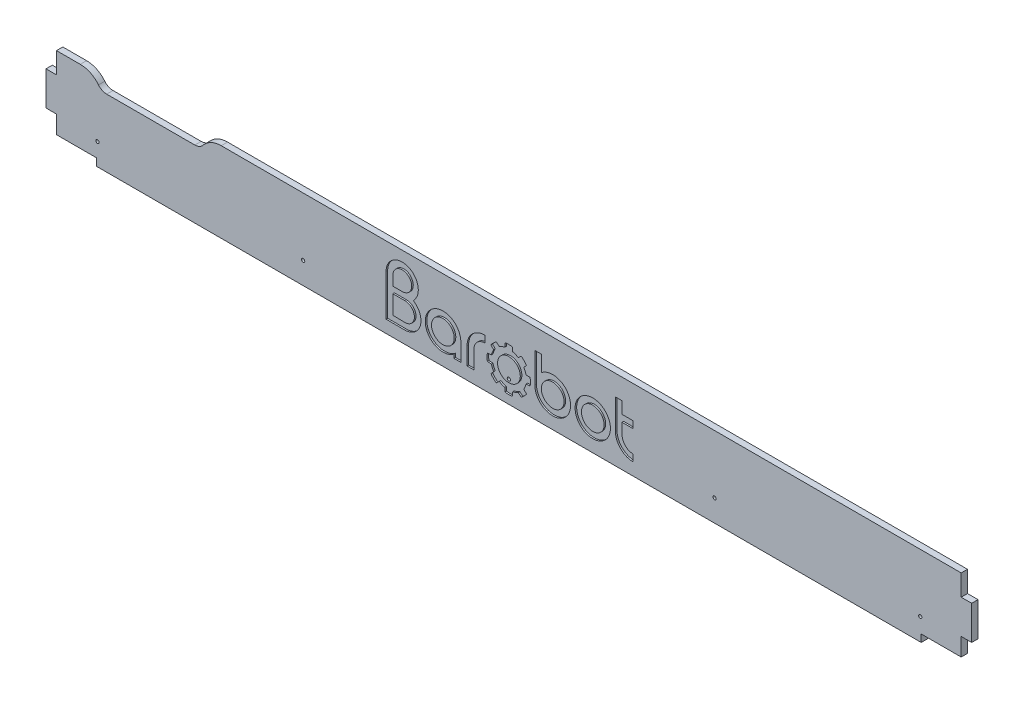
from build123d import *

# Parameters (mm, degrees)
DODANIE_WYCI_GNI_CIE1_DEPTH = 6
SZKIC3_R                    = 1.55
WYTNIJ_WYCI_GNI_CIE1_DEPTH  = 6
SZKIC18_R                   = 10.8
SZKIC18_R_2                 = 16.797100668
WYTNIJ_WYCI_GNI_CIE2_DEPTH  = 1.5


with BuildPart() as part:
    # Szkic2 → Dodanie-wyciągnięcie1 (new body)
    with BuildSketch(Plane.XY):
        with BuildLine():
            Line((-832, -462.603962956), (-48, -462.603962956))
            Line((-48, -462.603962956), (-48, -455.603962956))
            Line((-48, -455.603962956), (-10, -455.603962956))
            Line((-10, -455.603962956), (-10, -448.103962956))
            Line((-10, -448.103962956), (-10, -445.003962956))
            Line((-10, -445.003962956), (-10, -438.603962956))
            Line((-10, -438.603962956), (0, -438.603962956))
            Line((0, -438.603962956), (0, -406.323962956))
            Line((0, -406.323962956), (-10, -406.323962956))
            Line((-10, -406.323962956), (-10, -399.423962956))
            Line((-10, -399.423962956), (-10, -396.323962956))
            Line((-10, -396.323962956), (-10, -386.323962956))
            Line((-10, -386.323962956), (-713.404941199, -386.323962956))
            ThreePointArc((-713.404941199, -386.323962956), (-722.997493459, -388.499721921), (-730.71263052, -394.601168148))
            ThreePointArc((-730.71263052, -394.601168148), (-734.182626917, -397.345383352), (-738.49701842, -398.323962956))
            Line((-738.49701842, -398.323962956), (-822.314941199, -398.323962956))
            ThreePointArc((-822.314941199, -398.323962956), (-826.629332702, -397.345383352), (-830.099329099, -394.601168148))
            ThreePointArc((-830.099329099, -394.601168148), (-837.81446616, -388.499721921), (-847.40701842, -386.323962956))
            Line((-847.40701842, -386.323962956), (-870, -386.323962956))
            Line((-870, -386.323962956), (-870, -396.323962956))
            Line((-870, -396.323962956), (-870, -399.423962956))
            Line((-870, -399.423962956), (-870, -406.323962956))
            Line((-870, -406.323962956), (-880, -406.323962956))
            Line((-880, -406.323962956), (-880, -438.603962956))
            Line((-880, -438.603962956), (-870, -438.603962956))
            Line((-870, -438.603962956), (-870, -445.003962956))
            Line((-870, -445.003962956), (-870, -448.103962956))
            Line((-870, -448.103962956), (-870, -455.603962956))
            Line((-870, -455.603962956), (-832, -455.603962956))
            Line((-832, -455.603962956), (-832, -462.603962956))
        make_face()
    extrude(amount=DODANIE_WYCI_GNI_CIE1_DEPTH)

    # Szkic3 → Wytnij-wyciągnięcie1 (cut)
    with BuildSketch(Plane.XY.offset(6)):
        with Locations((-635.558, -441.762668339)):
            Circle(SZKIC3_R)
        with Locations((-831.114, -441.762668339)):
            Circle(SZKIC3_R)
        with Locations((-440.002, -441.762668339)):
            Circle(SZKIC3_R)
        with Locations((-244.446, -441.762668339)):
            Circle(SZKIC3_R)
        with Locations((-48.89, -441.762668339)):
            Circle(SZKIC3_R)
    extrude(amount=-WYTNIJ_WYCI_GNI_CIE1_DEPTH, mode=Mode.SUBTRACT)

    # Szkic18 → Wytnij-wyciągnięcie2 (cut)
    # profile 1 of 7: a face of its own
    with BuildSketch(Plane.XY.offset(6)):
        with BuildLine():
            Line((-408.875157463, -420.83301825), (-408.875157463, -420.603727366))
            add(Edge.make_bspline(
                [(-408.886440151, -405.761661732), (-408.88559352, -406.009029164), (-408.884111957, -406.503764274), (-408.882459085, -407.245867819), (-408.881310059, -407.987971303), (-408.88059925, -408.730074727), (-408.880261027, -409.472178103), (-408.880229763, -410.214281437), (-408.880439828, -410.956384739), (-408.880825592, -411.698488018), (-408.881321428, -412.440591283), (-408.881861705, -413.182694541), (-408.882380795, -413.924797803), (-408.882813068, -414.666901076), (-408.883092896, -415.409004369), (-408.883154649, -416.151107691), (-408.882932699, -416.893211051), (-408.882361416, -417.635314457), (-408.881375171, -418.377417918), (-408.879908334, -419.119521444), (-408.877895277, -419.861625036), (-408.876145342, -420.356360017), (-408.875157463, -420.603727366)],
                knots=[0, 0, 0, 0, 0.036520996, 0.073041919, 0.109562794, 0.146083642, 0.182604477, 0.219125308, 0.25564614, 0.292166975, 0.328687814, 0.365208654, 0.401729493, 0.43825033, 0.474771163, 0.511291994, 0.547812827, 0.584333669, 0.620854533, 0.657375436, 0.693896402, 0.730417464, 0.730417464, 0.730417464, 0.730417464], degree=3))
            add(Edge.make_bspline(
                [(-415.332394673, -405.764478098), (-415.22487586, -405.763631524), (-415.009851324, -405.762065338), (-414.687332423, -405.760075726), (-414.364851365, -405.758424781), (-414.042406067, -405.757091338), (-413.719994439, -405.756054238), (-413.397614393, -405.755292318), (-413.075263841, -405.754784417), (-412.752940694, -405.754509372), (-412.430642863, -405.754446022), (-412.10836826, -405.754573205), (-411.786114796, -405.754869759), (-411.463880384, -405.755314523), (-411.141662933, -405.755886334), (-410.819460357, -405.756564032), (-410.497270566, -405.757326454), (-410.175091471, -405.758152439), (-409.852920986, -405.759020825), (-409.530757019, -405.759910451), (-409.208597485, -405.760800154), (-408.993825674, -405.761379234), (-408.886440151, -405.761661732)],
                knots=[0, 0, 0, 0, 0.015874333, 0.031746582, 0.047616877, 0.063485341, 0.079352095, 0.095217259, 0.111080947, 0.126943274, 0.142804351, 0.158664286, 0.174523188, 0.19038116, 0.206238308, 0.222094735, 0.237950543, 0.253805832, 0.269660703, 0.285515256, 0.301369591, 0.317223807, 0.317223807, 0.317223807, 0.317223807], degree=3))
            add(Edge.make_bspline(
                [(-415.332394673, -434.175792999), (-415.332112609, -433.702230987), (-415.331604894, -432.755119663), (-415.330999857, -431.334470286), (-415.330538675, -429.913854796), (-415.330208654, -428.493268952), (-415.329997103, -427.072708508), (-415.329891327, -425.652169221), (-415.329878633, -424.231646846), (-415.329946329, -422.811137139), (-415.330081721, -421.390635856), (-415.330272117, -419.970138753), (-415.330504823, -418.549641587), (-415.330767146, -417.129140112), (-415.331046393, -415.708630085), (-415.331329871, -414.288107262), (-415.331604887, -412.867567398), (-415.331858747, -411.44700625), (-415.332078759, -410.026419573), (-415.33225223, -408.605803124), (-415.332366467, -407.185152657), (-415.332394673, -406.238040535), (-415.332394673, -405.764478098)],
                knots=[0, 0, 0, 0, 0.069915664, 0.139829447, 0.209741561, 0.279652213, 0.349561615, 0.419469975, 0.489377502, 0.559284406, 0.629190896, 0.699097181, 0.769003469, 0.838909969, 0.90881689, 0.978724441, 1.048632831, 1.118542268, 1.18845296, 1.258365118, 1.32827895, 1.398194664, 1.398194664, 1.398194664, 1.398194664], degree=3))
            ThreePointArc((-415.332394673, -434.175792999), (-383.0037542, -441.587364195), (-408.875157463, -420.83301825))
        make_face()
        with Locations((-398.318496681, -434.175792999)):
            Circle(SZKIC18_R, mode=Mode.SUBTRACT)
    # profile 2 of 7: a face of its own
    with BuildSketch(Plane.XY.offset(6)):
        with Locations((-360.238496681, -434.167326677)):
            Circle(SZKIC18_R_2)
        with Locations((-360.238496681, -434.167326677)):
            Circle(SZKIC18_R, mode=Mode.SUBTRACT)
    # profile 3 of 7: a face of its own
    with BuildSketch(Plane.XY.offset(6)):
        with BuildLine():
            ThreePointArc((-338.773975551, -434.167326677), (-333.735546776, -445.950684873), (-321.882982441, -450.824083438))
            add(Edge.make_bspline(
                [(-321.885790194, -444.386590932), (-321.884802382, -444.493969198), (-321.882953762, -444.708712498), (-321.880546938, -445.030809617), (-321.878491595, -445.352868527), (-321.876772914, -445.674891349), (-321.875376078, -445.996880211), (-321.874286268, -446.318837238), (-321.873488665, -446.640764558), (-321.872968451, -446.962664295), (-321.872710807, -447.284538576), (-321.872700916, -447.606389528), (-321.872923958, -447.928219276), (-321.873365116, -448.250029947), (-321.87400957, -448.571823667), (-321.874842503, -448.893602563), (-321.875849095, -449.21536876), (-321.87701453, -449.537124384), (-321.878323988, -449.858871562), (-321.879762651, -450.180612421), (-321.8813157, -450.502349085), (-321.882417445, -450.716838878), (-321.882982441, -450.824083438)],
                knots=[0, 0, 0, 0, 0.015853761, 0.031705394, 0.047555027, 0.063402788, 0.079248802, 0.095093192, 0.110936079, 0.126777581, 0.142617816, 0.158456899, 0.174294942, 0.190132058, 0.205968358, 0.22180395, 0.237638942, 0.25347344, 0.26930755, 0.285141378, 0.300975025, 0.316808595, 0.316808595, 0.316808595, 0.316808595], degree=3))
            add(Edge.make_bspline(
                [(-327.044820684, -442.992412465), (-326.967032964, -443.038352289), (-326.81016046, -443.127665765), (-326.57102396, -443.25411768), (-326.328555563, -443.373031599), (-326.082953512, -443.484556855), (-325.834412013, -443.588845102), (-325.583126207, -443.686047357), (-325.329290849, -443.776314773), (-325.073100682, -443.859798416), (-324.814750347, -443.936649317), (-324.554434426, -444.007018451), (-324.292347443, -444.071056736), (-324.028683881, -444.128915032), (-323.763638186, -444.180744143), (-323.49740478, -444.226694814), (-323.230178073, -444.266917741), (-322.962152437, -444.301563567), (-322.693522342, -444.330782886), (-322.424481873, -444.354726264), (-322.155226553, -444.373544167), (-321.975592926, -444.382778735), (-321.885790194, -444.386590932)],
                knots=[0, 0, 0, 0, 0.013337665, 0.026645695, 0.039931703, 0.053202365, 0.066463438, 0.079719779, 0.092975376, 0.106233374, 0.119496105, 0.132765122, 0.146041233, 0.159324536, 0.172614451, 0.185909758, 0.199208627, 0.212508654, 0.225806893, 0.239099883, 0.252383684, 0.265653903, 0.265653903, 0.265653903, 0.265653903], degree=3))
            add(Edge.make_bspline(
                [(-331.994992261, -436.498484988), (-331.960714717, -436.634043709), (-331.886445005, -436.903693824), (-331.758308066, -437.303090973), (-331.613859317, -437.696789564), (-331.453497803, -438.084242144), (-331.277619224, -438.464913339), (-331.086619804, -438.83826452), (-330.880895272, -439.20375787), (-330.660841158, -439.560855266), (-330.426852736, -439.909018545), (-330.179325057, -440.247709408), (-329.918652963, -440.576389421), (-329.645231096, -440.894519992), (-329.359453919, -441.201562351), (-329.061715714, -441.496977536), (-328.752410663, -441.780226335), (-328.431932604, -442.050769411), (-328.10067606, -442.308066708), (-327.759032495, -442.551579552), (-327.407404424, -442.780762695), (-327.166677857, -442.923586207), (-327.044820684, -442.992412465)],
                knots=[0, 0, 0, 0, 0.0206435, 0.041278649, 0.061909655, 0.082539537, 0.103170281, 0.123802999, 0.144438081, 0.165075361, 0.185714269, 0.20635399, 0.226993622, 0.247632337, 0.268269532, 0.288904993, 0.309539047, 0.330172725, 0.350807919, 0.371447535, 0.392095653, 0.41275768, 0.41275768, 0.41275768, 0.41275768], degree=3))
            add(Edge.make_bspline(
                [(-332.328012416, -432.564306521), (-332.328719153, -432.630110137), (-332.330033313, -432.761798114), (-332.331469514, -432.959436854), (-332.332135084, -433.157267407), (-332.331793037, -433.355237286), (-332.330206367, -433.553294016), (-332.327138043, -433.751385126), (-332.322350999, -433.94945815), (-332.315608134, -434.147460626), (-332.306672303, -434.345340099), (-332.295306312, -434.54304411), (-332.281272915, -434.740520201), (-332.264334803, -434.937715904), (-332.244254603, -435.134578737), (-332.220794873, -435.331056195), (-332.193718102, -435.527095733), (-332.162786692, -435.722644797), (-332.127763014, -435.91765063), (-332.088409219, -436.112060951), (-332.044487949, -436.305821336), (-332.01204457, -436.434363574), (-331.994992261, -436.498484988)],
                knots=[0, 0, 0, 0, 0.009715661, 0.019443075, 0.029179667, 0.038922996, 0.048670799, 0.058421035, 0.068171922, 0.077921984, 0.087670095, 0.097415518, 0.107157954, 0.116897583, 0.126635112, 0.136371816, 0.146109585, 0.155850962, 0.165599192, 0.175358252, 0.185132896, 0.194928679, 0.194928679, 0.194928679, 0.194928679], degree=3))
            add(Edge.make_bspline(
                [(-332.319554707, -423.513437788), (-332.320401414, -423.664157717), (-332.321939578, -423.965623937), (-332.323819107, -424.417861477), (-332.325309212, -424.87017101), (-332.326447975, -425.322546177), (-332.327273482, -425.77498063), (-332.327823819, -426.227468017), (-332.328137069, -426.680001985), (-332.328251317, -427.132576185), (-332.328204649, -427.585184263), (-332.328035149, -428.03781987), (-332.327780901, -428.490476653), (-332.327479991, -428.943148262), (-332.327170503, -429.395828345), (-332.326890522, -429.84851055), (-332.326678133, -430.301188526), (-332.32657142, -430.753855921), (-332.326608468, -431.206506385), (-332.326827362, -431.659133567), (-332.327266187, -432.111731111), (-332.327730767, -432.413452081), (-332.328012416, -432.564306521)],
                knots=[0, 0, 0, 0, 0.022252309, 0.044508379, 0.066767922, 0.089030646, 0.111296257, 0.133564453, 0.155834932, 0.178107388, 0.20038151, 0.22265699, 0.244933515, 0.26721077, 0.289488443, 0.31176622, 0.334043786, 0.356320829, 0.378597037, 0.400872101, 0.423145713, 0.445417569, 0.445417569, 0.445417569, 0.445417569], degree=3))
            add(Edge.make_bspline(
                [(-321.882982441, -423.502146487), (-322.0569647, -423.502852272), (-322.404916849, -423.504080375), (-322.926828428, -423.505431394), (-323.448706272, -423.506350482), (-323.970554608, -423.506896921), (-324.492377674, -423.507129988), (-325.014179702, -423.507108967), (-325.535964928, -423.506893135), (-326.057737587, -423.506541774), (-326.579501913, -423.506114162), (-327.10126214, -423.505669582), (-327.623022504, -423.505267312), (-328.144787239, -423.504966632), (-328.66656058, -423.504826823), (-329.188346761, -423.504907164), (-329.710150017, -423.505266936), (-330.231974583, -423.505965419), (-330.753824692, -423.507061893), (-331.275704583, -423.508615639), (-331.797618479, -423.510685936), (-332.145571845, -423.512449949), (-332.319554707, -423.513437788)],
                knots=[0, 0, 0, 0, 0.025686568, 0.051371198, 0.077054124, 0.102735574, 0.128415772, 0.154094934, 0.179773273, 0.205450998, 0.231128316, 0.256805434, 0.282482556, 0.308159889, 0.333837641, 0.359516023, 0.385195248, 0.410875537, 0.436557114, 0.462240209, 0.487925064, 0.513611924, 0.513611924, 0.513611924, 0.513611924], degree=3))
            add(Edge.make_bspline(
                [(-321.885790194, -417.016685333), (-321.884802318, -417.124775978), (-321.882939475, -417.340957383), (-321.880475475, -417.665230891), (-321.878333291, -417.989504285), (-321.87650446, -418.313777577), (-321.874980521, -418.638050779), (-321.87375301, -418.962323904), (-321.872813468, -419.286596967), (-321.87215343, -419.61086998), (-321.871764435, -419.935142957), (-321.871638022, -420.25941591), (-321.871765727, -420.583688854), (-321.87213909, -420.907961801), (-321.872749647, -421.232234764), (-321.873588937, -421.556507757), (-321.874648498, -421.880780793), (-321.875919868, -422.205053886), (-321.877394585, -422.529327048), (-321.879064186, -422.853600293), (-321.880920211, -423.177873633), (-321.882276198, -423.394055529), (-321.882982441, -423.502146487)],
                knots=[0, 0, 0, 0, 0.015958931, 0.031917724, 0.0478764, 0.063834977, 0.079793472, 0.095751903, 0.111710283, 0.127668627, 0.143626949, 0.159585259, 0.17554357, 0.19150189, 0.207460229, 0.223418596, 0.239376996, 0.255335438, 0.271293925, 0.287252463, 0.303211056, 0.319169708, 0.319169708, 0.319169708, 0.319169708], degree=3))
            add(Edge.make_bspline(
                [(-332.319554707, -417.005394032), (-332.145572126, -417.006522682), (-331.79761992, -417.008540154), (-331.275709069, -417.010912509), (-330.753836456, -417.012696496), (-330.231999963, -417.013957731), (-329.710197454, -417.014761832), (-329.188426801, -417.015174415), (-328.666685871, -417.015261097), (-328.144972534, -417.015087496), (-327.623284659, -417.014719227), (-327.101620114, -417.014221907), (-326.579976768, -417.013661152), (-326.05835249, -417.01310258), (-325.53674515, -417.012611806), (-325.015152615, -417.012254448), (-324.493572756, -417.012096121), (-323.97200344, -417.012202443), (-323.450442537, -417.01263903), (-322.928887913, -417.013471499), (-322.407337447, -417.014765466), (-322.059638944, -417.01597952), (-321.885790194, -417.016685333)],
                knots=[0, 0, 0, 0, 0.025686945, 0.051371742, 0.077054546, 0.102735503, 0.128414745, 0.154092401, 0.17976859, 0.205443423, 0.23111701, 0.256789455, 0.282460861, 0.308131328, 0.333800958, 0.359469852, 0.385138117, 0.410805859, 0.436473194, 0.462140239, 0.487807123, 0.513473981, 0.513473981, 0.513473981, 0.513473981], degree=3))
            add(Edge.make_bspline(
                [(-332.325204663, -405.764478098), (-332.32506342, -405.951867189), (-332.324879709, -406.326632675), (-332.324858166, -406.88876324), (-332.325048317, -407.450859767), (-332.325407828, -408.012926502), (-332.325894361, -408.574967695), (-332.326465581, -409.136987594), (-332.32707915, -409.698990447), (-332.327692733, -410.260980505), (-332.328263992, -410.822962015), (-332.328750593, -411.384939226), (-332.329110197, -411.946916386), (-332.329300469, -412.508897745), (-332.329279073, -413.070887552), (-332.329003672, -413.632890054), (-332.328431929, -414.194909501), (-332.327521508, -414.756950141), (-332.326230073, -415.319016222), (-332.324515286, -415.881111996), (-332.322334812, -416.443241704), (-332.32054255, -416.81800577), (-332.319554707, -417.005394032)],
                knots=[0, 0, 0, 0, 0.02766572, 0.055329554, 0.082991715, 0.110652415, 0.138311864, 0.165970268, 0.193627837, 0.221284775, 0.248941291, 0.276597591, 0.304253882, 0.331910376, 0.359567283, 0.387224816, 0.414883193, 0.442542633, 0.47020336, 0.497865602, 0.525529591, 0.553195566, 0.553195566, 0.553195566, 0.553195566], degree=3))
            add(Edge.make_bspline(
                [(-338.768325594, -405.764478098), (-338.661067834, -405.763913892), (-338.446526172, -405.762827795), (-338.124676269, -405.761332077), (-337.802754324, -405.759975935), (-337.480766694, -405.758765725), (-337.158719734, -405.757707803), (-336.836619802, -405.756808525), (-336.514473253, -405.756074247), (-336.192286443, -405.755511326), (-335.870065729, -405.755126116), (-335.547817465, -405.754924974), (-335.225548008, -405.754914257), (-334.903263714, -405.75510032), (-334.580970939, -405.755489519), (-334.258676039, -405.75608821), (-333.936385371, -405.75690275), (-333.614105289, -405.757939494), (-333.291842151, -405.759204798), (-332.969602311, -405.760705019), (-332.647392128, -405.762446512), (-332.432596454, -405.763772672), (-332.325204663, -405.764478098)],
                knots=[0, 0, 0, 0, 0.015835518, 0.031674863, 0.047517722, 0.063363785, 0.079212741, 0.09506428, 0.110918092, 0.126773868, 0.1426313, 0.158490079, 0.174349898, 0.190210449, 0.206071427, 0.221932524, 0.237793437, 0.253653859, 0.269513487, 0.285372018, 0.30122915, 0.317084579, 0.317084579, 0.317084579, 0.317084579], degree=3))
            add(Edge.make_bspline(
                [(-338.773975551, -434.167326677), (-338.773693057, -433.6939059), (-338.773212815, -432.747076997), (-338.772717028, -431.326851182), (-338.772416165, -429.906659156), (-338.772280564, -428.486496687), (-338.772280564, -427.066359545), (-338.7723865, -425.646243496), (-338.772568711, -424.226144308), (-338.772797534, -422.806057751), (-338.773043308, -421.385979592), (-338.773276369, -419.965905599), (-338.773467055, -418.54583154), (-338.773585704, -417.125753183), (-338.773602654, -415.705666296), (-338.773488241, -414.285566647), (-338.773212804, -412.865450005), (-338.77274668, -411.445312137), (-338.772060207, -410.025148812), (-338.771123723, -408.604955797), (-338.769907564, -407.184728861), (-338.768890582, -406.237899245), (-338.768325594, -405.764478098)],
                knots=[0, 0, 0, 0, 0.069894812, 0.139787749, 0.20967902, 0.279568836, 0.349457405, 0.419344937, 0.489231639, 0.55911772, 0.629003388, 0.698888851, 0.768774316, 0.838659993, 0.908546089, 0.978432813, 1.048320374, 1.118208982, 1.188098847, 1.25799018, 1.327883192, 1.397778096, 1.397778096, 1.397778096, 1.397778096], degree=3))
        make_face()
    # profile 4 of 7: a face of its own
    with BuildSketch(Plane.XY.offset(6)):
        with BuildLine():
            add(Edge.make_bspline(
                [(-548.00788481, -397.611082577), (-547.878366266, -397.548580788), (-547.617510496, -397.427372829), (-547.22115381, -397.257026484), (-546.820097566, -397.098212056), (-546.414684562, -396.950982053), (-546.00525202, -396.815386346), (-545.592138617, -396.691475566), (-545.175682605, -396.57930019), (-544.756222323, -396.478910794), (-544.334096061, -396.39035798), (-543.909642103, -396.313692401), (-543.483198719, -396.24896475), (-543.055104171, -396.196225769), (-542.625696717, -396.155526242), (-542.195314603, -396.126917003), (-541.764296111, -396.110448926), (-541.332979407, -396.106172947), (-540.901703099, -396.114139998), (-540.470804197, -396.134401251), (-540.040625736, -396.167007205), (-539.75456099, -396.197006986), (-539.611774776, -396.214079132)],
                knots=[0, 0, 0, 0, 0.0212319, 0.042459492, 0.063684291, 0.084907463, 0.106129873, 0.127352121, 0.148574585, 0.169797457, 0.191020787, 0.212244522, 0.233468543, 0.254692712, 0.275916906, 0.297141057, 0.3183652, 0.339589501, 0.36081431, 0.38204019, 0.403267963, 0.424498751, 0.424498751, 0.424498751, 0.424498751], degree=3))
            add(Edge.make_bspline(
                [(-555.035218574, -404.502953033), (-554.960453668, -404.353423113), (-554.805793908, -404.056977836), (-554.55882159, -403.620580119), (-554.297311263, -403.192909334), (-554.021660371, -402.774333407), (-553.732261798, -402.365211417), (-553.429509487, -401.965904847), (-553.113796948, -401.576774584), (-552.785517663, -401.198181733), (-552.44506499, -400.830487413), (-552.092832198, -400.474052817), (-551.729212466, -400.129239205), (-551.354598892, -399.796407912), (-550.969384499, -399.475920359), (-550.573962234, -399.168138048), (-550.168725023, -398.873422596), (-549.754065572, -398.592135642), (-549.330377159, -398.324639227), (-548.898050712, -398.071294404), (-548.457485756, -397.832466467), (-548.158565793, -397.683177844), (-548.00788481, -397.611082577)],
                knots=[0, 0, 0, 0, 0.024682014, 0.049353343, 0.074017421, 0.098676933, 0.12333389, 0.147989719, 0.172645344, 0.197301269, 0.221957663, 0.246614446, 0.271271373, 0.295928115, 0.320584347, 0.345239831, 0.369894499, 0.394548539, 0.41920248, 0.443857274, 0.468514381, 0.493175854, 0.493175854, 0.493175854, 0.493175854], degree=3))
            add(Edge.make_bspline(
                [(-556.674929669, -411.527459665), (-556.6759175, -411.406097827), (-556.67502807, -411.163325197), (-556.665115345, -410.799286192), (-556.646638861, -410.435541697), (-556.619613412, -410.07230586), (-556.584053807, -409.709789446), (-556.539974827, -409.348204127), (-556.487391241, -408.987761337), (-556.426317797, -408.628672577), (-556.356769228, -408.271149338), (-556.27876025, -407.915403118), (-556.19230556, -407.561645423), (-556.09741984, -407.210087765), (-555.994117753, -406.86094167), (-555.882413947, -406.514418665), (-555.762323058, -406.170730311), (-555.633859675, -405.830088113), (-555.497038496, -405.492703843), (-555.351873728, -405.158788355), (-555.198381348, -404.828556009), (-555.090524188, -404.611024336), (-555.035218574, -404.502953033)],
                knots=[0, 0, 0, 0, 0.017918188, 0.035838726, 0.053761117, 0.071684836, 0.089609354, 0.107534149, 0.125458729, 0.143382649, 0.16130553, 0.179227076, 0.197147092, 0.215065503, 0.232982373, 0.250897923, 0.268812548, 0.286726835, 0.304641586, 0.322557829, 0.340476842, 0.358400166, 0.358400166, 0.358400166, 0.358400166], degree=3))
            add(Edge.make_bspline(
                [(-556.680574108, -450.804325815), (-556.680009664, -450.149711435), (-556.678993665, -448.840482664), (-556.6777787, -446.876639408), (-556.676843134, -444.912796203), (-556.676157335, -442.94895304), (-556.675691669, -440.985109907), (-556.675416502, -439.021266794), (-556.675302202, -437.057423692), (-556.675319136, -435.09358059), (-556.675437669, -433.129737476), (-556.675628169, -431.165894342), (-556.675861002, -429.202051177), (-556.676106535, -427.23820797), (-556.676335135, -425.27436471), (-556.676517168, -423.310521389), (-556.676623001, -421.346677994), (-556.676623001, -419.382834517), (-556.676487534, -417.418990946), (-556.676186968, -415.455147271), (-556.675691669, -413.491303482), (-556.675211891, -412.182074279), (-556.674929669, -411.527459665)],
                knots=[0, 0, 0, 0, 0.09664586, 0.193291706, 0.289937543, 0.386583373, 0.483229198, 0.579875021, 0.676520843, 0.773166664, 0.869812487, 0.966458311, 1.063104136, 1.159749964, 1.256395794, 1.353041627, 1.449687464, 1.546333304, 1.642979148, 1.739624999, 1.836270857, 1.932916724, 1.932916724, 1.932916724, 1.932916724], degree=3))
            add(Edge.make_bspline(
                [(-538.909039892, -450.818437788), (-539.205231973, -450.817873438), (-539.7976163, -450.816942272), (-540.686193202, -450.816064044), (-541.574770052, -450.815630259), (-542.463346852, -450.815566839), (-543.351923615, -450.815799706), (-544.240500347, -450.816254782), (-545.129077059, -450.816857988), (-546.017653758, -450.817535246), (-546.906230455, -450.818212478), (-547.794807157, -450.818815607), (-548.683383873, -450.819270553), (-549.571960613, -450.81950324), (-550.460537385, -450.819439587), (-551.349114198, -450.819005518), (-552.237691061, -450.818126954), (-553.126267983, -450.816729816), (-554.014844972, -450.814740027), (-554.90342204, -450.812083507), (-555.791999184, -450.808686179), (-556.384382608, -450.805878042), (-556.680574108, -450.804325815)],
                knots=[0, 0, 0, 0, 0.043729225, 0.087458417, 0.131187593, 0.174916763, 0.218645934, 0.26237511, 0.306104289, 0.349833471, 0.393562653, 0.437291832, 0.481021006, 0.524750176, 0.568479345, 0.612208519, 0.655937709, 0.699666932, 0.74339621, 0.787125575, 0.830855063, 0.874584724, 0.874584724, 0.874584724, 0.874584724], degree=3))
            add(Edge.make_bspline(
                [(-530.352062201, -448.250213843), (-530.477637312, -448.33430692), (-530.731351849, -448.498672066), (-531.119178178, -448.733580012), (-531.513871917, -448.956711023), (-531.915052006, -449.167931288), (-532.322343248, -449.367110848), (-532.735368927, -449.554118646), (-533.153752781, -449.728823851), (-533.577118469, -449.891095506), (-534.005089706, -450.040802613), (-534.437290222, -450.177814114), (-534.873343768, -450.301998891), (-535.312874107, -450.413225766), (-535.755505014, -450.511363498), (-536.200860274, -450.596280783), (-536.648563637, -450.66784625), (-537.098238991, -450.72592846), (-537.549509683, -450.770395911), (-538.002001009, -450.801117013), (-538.455330909, -450.817960174), (-538.757807578, -450.819848624), (-538.909039892, -450.818437788)],
                knots=[0, 0, 0, 0, 0.022312733, 0.044623204, 0.066932505, 0.089241385, 0.111550312, 0.133859512, 0.156169033, 0.178478787, 0.200788607, 0.2230983, 0.245407694, 0.267716694, 0.290025332, 0.312333819, 0.334642597, 0.356952392, 0.379264264, 0.401579657, 0.423900457, 0.446229034, 0.446229034, 0.446229034, 0.446229034], degree=3))
            add(Edge.make_bspline(
                [(-524.160108109, -439.803304799), (-524.209050276, -439.974813941), (-524.313314533, -440.315924105), (-524.488439079, -440.821304903), (-524.681810982, -441.319729492), (-524.893003361, -441.810698728), (-525.121592945, -442.293725454), (-525.367155761, -442.768319317), (-525.629268273, -443.233990811), (-525.907507066, -443.690250167), (-526.201448915, -444.136607633), (-526.510670755, -444.572573377), (-526.834749672, -444.997657503), (-527.173262897, -445.411370028), (-527.525787792, -445.813220876), (-527.891901854, -446.202719875), (-528.271182651, -446.579376709), (-528.663208036, -446.942701057), (-529.067555288, -447.292202015), (-529.483804293, -447.627390213), (-529.911525618, -447.947769846), (-530.204048941, -448.151162206), (-530.352062201, -448.250213843)],
                knots=[0, 0, 0, 0, 0.026332028, 0.052646462, 0.078949141, 0.105244721, 0.131536784, 0.157827959, 0.18412003, 0.210414055, 0.236710481, 0.263009262, 0.289309972, 0.315611925, 0.34191429, 0.368216205, 0.394516895, 0.420815788, 0.44711263, 0.473407603, 0.499701441, 0.525995542, 0.525995542, 0.525995542, 0.525995542], degree=3))
            add(Edge.make_bspline(
                [(-524.337907334, -430.670589209), (-524.288672143, -430.817307691), (-524.194787389, -431.112246977), (-524.067751384, -431.558718697), (-523.954542077, -432.008763974), (-523.855173577, -432.461962719), (-523.769657664, -432.917902013), (-523.69800682, -433.376167058), (-523.640233423, -433.836343597), (-523.596349963, -434.298017258), (-523.566368983, -434.760773719), (-523.550303096, -435.224198661), (-523.548164982, -435.68787777), (-523.559967386, -436.151396734), (-523.585723122, -436.614341235), (-523.625445073, -437.076296951), (-523.679146179, -437.53684951), (-523.746839487, -437.995584656), (-523.828537958, -438.452087584), (-523.924255195, -438.90594541), (-524.034002714, -439.356737896), (-524.11651607, -439.654894707), (-524.160108109, -439.803304799)],
                knots=[0, 0, 0, 0, 0.02284831, 0.045688355, 0.068522095, 0.091351076, 0.114176485, 0.136999203, 0.159819859, 0.182638886, 0.205456576, 0.228273134, 0.251088731, 0.273903563, 0.296717903, 0.319532157, 0.342346917, 0.365163019, 0.387981595, 0.410804128, 0.433632508, 0.456469083, 0.456469083, 0.456469083, 0.456469083], degree=3))
            add(Edge.make_bspline(
                [(-530.792330331, -422.51436871), (-530.642070378, -422.607628854), (-530.344851319, -422.799480128), (-529.909455012, -423.102720396), (-529.484926158, -423.420942859), (-529.071687934, -423.753675207), (-528.670154134, -424.100451141), (-528.280741156, -424.460802935), (-527.903864804, -424.834263417), (-527.539941157, -425.220365426), (-527.189386347, -425.618641944), (-526.852616632, -426.02862605), (-526.530048381, -426.449850917), (-526.222098095, -426.881849804), (-525.929182408, -427.324156042), (-525.651718099, -427.77630304), (-525.390122119, -428.237824205), (-525.144811514, -428.708253196), (-524.91620377, -429.187122888), (-524.704715564, -429.67396919), (-524.510767492, -430.168316686), (-524.393480132, -430.502460684), (-524.337907334, -430.670589209)],
                knots=[0, 0, 0, 0, 0.026109571, 0.052215487, 0.078319777, 0.104423784, 0.130528268, 0.156633519, 0.182739467, 0.208845788, 0.234952016, 0.261057651, 0.28716227, 0.313265633, 0.339367796, 0.365469217, 0.391570868, 0.417674344, 0.44378197, 0.46989691, 0.496023275, 0.52216623, 0.52216623, 0.52216623, 0.52216623], degree=3))
            add(Edge.make_bspline(
                [(-528.630507076, -419.841723921), (-528.661666566, -419.890084925), (-528.724859154, -419.986153728), (-528.822136217, -420.128467831), (-528.92165519, -420.269007894), (-529.023246223, -420.407904944), (-529.126740079, -420.545290869), (-529.231967426, -420.681297304), (-529.338759025, -420.816055933), (-529.446945666, -420.949698398), (-529.556358178, -421.082356328), (-529.666827422, -421.214161329), (-529.778184282, -421.345244987), (-529.890259665, -421.475738874), (-530.00288449, -421.605774545), (-530.115889693, -421.735483543), (-530.229106214, -421.864997405), (-530.342365002, -421.994447662), (-530.455496999, -422.12396584), (-530.568333166, -422.253683489), (-530.680704394, -422.383732087), (-530.755210703, -422.470756807), (-530.792330331, -422.51436871)],
                knots=[0, 0, 0, 0, 0.008493602, 0.016975615, 0.025449171, 0.033916888, 0.042380901, 0.050842903, 0.059304179, 0.067765648, 0.076227899, 0.084691232, 0.093155698, 0.101621136, 0.110087217, 0.118553478, 0.127019365, 0.135484271, 0.143947575, 0.152408684, 0.160867066, 0.169322298, 0.169322298, 0.169322298, 0.169322298], degree=3))
            add(Edge.make_bspline(
                [(-526.121551692, -410.618703765), (-526.112242626, -410.780766981), (-526.099048143, -411.105118378), (-526.095406936, -411.591869261), (-526.10777814, -412.078217331), (-526.136017629, -412.563700937), (-526.179980846, -413.047867528), (-526.239523476, -413.530262163), (-526.314501259, -414.010430571), (-526.404770043, -414.487918323), (-526.510185767, -414.96227104), (-526.630604461, -415.433034329), (-526.765882248, -415.899753788), (-526.915875335, -416.361974998), (-527.080440015, -416.819243513), (-527.259432671, -417.271104863), (-527.452709741, -417.717104504), (-527.660127835, -418.156787983), (-527.881543291, -418.589700275), (-528.11681381, -419.015388232), (-528.365792351, -419.433391404), (-528.540786757, -419.706579366), (-528.630507076, -419.841723921)],
                knots=[0, 0, 0, 0, 0.023966096, 0.047915632, 0.07185242, 0.095779635, 0.11969988, 0.143615254, 0.16752742, 0.191437676, 0.215347018, 0.239256217, 0.263165882, 0.287076531, 0.31098866, 0.334902815, 0.358819655, 0.382740029, 0.406665037, 0.430596105, 0.45453505, 0.478484152, 0.478484152, 0.478484152, 0.478484152], degree=3))
            add(Edge.make_bspline(
                [(-530.431086231, -400.732459665), (-530.302013661, -400.863507215), (-530.048879589, -401.130476849), (-529.684598537, -401.544839143), (-529.336115145, -401.972366658), (-529.003733547, -402.412396037), (-528.687748663, -402.864273583), (-528.388458052, -403.32734325), (-528.106158744, -403.800949839), (-527.841148108, -404.284438114), (-527.593723631, -404.777153015), (-527.364182985, -405.278439578), (-527.152824019, -405.787642939), (-526.959944773, -406.304108307), (-526.785843481, -406.827180952), (-526.630818582, -407.356206203), (-526.49516873, -407.890529343), (-526.379192786, -408.429495924), (-526.283189882, -408.972450506), (-526.207459232, -409.518741232), (-526.152300858, -410.067702634), (-526.12945055, -410.434913499), (-526.121551692, -410.618703765)],
                knots=[0, 0, 0, 0, 0.027156201, 0.054300451, 0.081436893, 0.108568623, 0.135697829, 0.162825924, 0.189953688, 0.217081408, 0.244209014, 0.27133622, 0.298462664, 0.325588046, 0.352712266, 0.379835566, 0.406958667, 0.43408291, 0.461210392, 0.488344108, 0.515488086, 0.542647524, 0.542647524, 0.542647524, 0.542647524], degree=3))
            add(Edge.make_bspline(
                [(-539.611774776, -396.214079132), (-539.438827039, -396.232841237), (-539.093651368, -396.2766908), (-538.578704908, -396.361146327), (-538.067220621, -396.463967744), (-537.559750467, -396.584852623), (-537.056834782, -396.723499966), (-536.559016978, -396.879608624), (-536.066839627, -397.052877712), (-535.580845533, -397.243006491), (-535.101577462, -397.449694388), (-534.629578235, -397.672640983), (-534.165390713, -397.911546002), (-533.709557818, -398.166109313), (-533.262622543, -398.436030915), (-532.825127951, -398.721010944), (-532.397617232, -399.020749621), (-531.980633534, -399.334947433), (-531.574720664, -399.66330441), (-531.180420519, -400.0055228), (-530.79828274, -400.361297057), (-530.55200179, -400.607311422), (-530.431086231, -400.732459665)],
                knots=[0, 0, 0, 0, 0.025683434, 0.051357093, 0.077025469, 0.102692022, 0.128359296, 0.154029022, 0.179702228, 0.205379352, 0.231060346, 0.25674479, 0.282432001, 0.308121138, 0.333811317, 0.359501717, 0.38519169, 0.410880868, 0.436569277, 0.462257442, 0.487946497, 0.513638297, 0.513638297, 0.513638297, 0.513638297], degree=3))
        make_face()
        with BuildLine():
            Line((-539.065542549, -444.576931302), (-550.301657461, -444.386590932))
            Line((-550.301657461, -444.386590932), (-550.301657461, -426.638079132))
            Line((-550.301657461, -426.638079132), (-538.761657461, -426.638079132))
            ThreePointArc((-538.761657461, -426.638079132), (-529.790944511, -435.762043475), (-539.065542549, -444.576931302))
        make_face(mode=Mode.SUBTRACT)
        with BuildLine():
            Line((-550.301657461, -420.398079132), (-550.301657461, -411.426079132))
            ThreePointArc((-550.301657461, -411.426079132), (-534.98549542, -405.081917091), (-541.329657461, -420.398079132))
            Line((-541.329657461, -420.398079132), (-550.301657461, -420.398079132))
        make_face(mode=Mode.SUBTRACT)
    # profile 5 of 7: a face of its own
    with BuildSketch(Plane.XY.offset(6)):
        with BuildLine():
            add(Edge.make_bspline(
                [(-443.667504061, -413.590503421), (-443.549121752, -413.570185049), (-443.312028183, -413.531536791), (-442.955492213, -413.479559591), (-442.598180035, -413.433610441), (-442.240192399, -413.393719219), (-441.881628388, -413.359915521), (-441.522587535, -413.332229024), (-441.163169252, -413.310689386), (-440.803472985, -413.295326275), (-440.44359817, -413.28616936), (-440.08364425, -413.283248315), (-439.723710667, -413.286592816), (-439.363896864, -413.296232545), (-439.00430229, -413.312197184), (-438.645026389, -413.334516422), (-438.28616862, -413.363219947), (-437.927828407, -413.39833746), (-437.57010532, -413.439898636), (-437.213098395, -413.487933254), (-436.856908673, -413.54247073), (-436.620109307, -413.583175649), (-436.501886318, -413.6046197)],
                knots=[0, 0, 0, 0, 0.017733264, 0.035464008, 0.053192208, 0.070917884, 0.0886411, 0.106361973, 0.124080671, 0.141797425, 0.15951253, 0.177226345, 0.194939308, 0.212651928, 0.230364799, 0.2480786, 0.265794101, 0.283512165, 0.301233753, 0.318959933, 0.336691875, 0.354430863, 0.354430863, 0.354430863, 0.354430863], degree=3))
            add(Edge.make_bspline(
                [(-443.884820684, -417.408969743), (-443.8805873, -417.345331612), (-443.872656455, -417.218022622), (-443.862154883, -417.026980858), (-443.852834661, -416.835881712), (-443.844481948, -416.644737708), (-443.836882906, -416.453561136), (-443.829823714, -416.262364351), (-443.823090564, -416.071159689), (-443.81646965, -415.879959492), (-443.80974717, -415.688776098), (-443.80270932, -415.497621848), (-443.795142291, -415.306509082), (-443.786832261, -415.115450139), (-443.777565398, -414.92445736), (-443.767127849, -414.733543084), (-443.75530574, -414.542719658), (-443.74188517, -414.351999419), (-443.726652214, -414.161394756), (-443.709392892, -413.970917901), (-443.689893266, -413.780581713), (-443.675262534, -413.653838529), (-443.667504061, -413.590503421)],
                knots=[0, 0, 0, 0, 0.009416159, 0.01883182, 0.02824737, 0.037662999, 0.047078737, 0.056494492, 0.06591008, 0.075325264, 0.084739788, 0.094153414, 0.103565955, 0.112977313, 0.122387512, 0.131796734, 0.141205358, 0.15061399, 0.160023501, 0.169435063, 0.178850183, 0.188270735, 0.188270735, 0.188270735, 0.188270735], degree=3))
            add(Edge.make_bspline(
                [(-449.072066507, -419.559501698), (-448.991513327, -419.51111365), (-448.82967701, -419.415628337), (-448.584763222, -419.276241234), (-448.337809119, -419.140711104), (-448.088874777, -419.009019329), (-447.838019265, -418.881146691), (-447.58530192, -418.757074131), (-447.330782002, -418.636782551), (-447.074518789, -418.520252864), (-446.81657155, -418.407465979), (-446.556999554, -418.298402809), (-446.295862068, -418.193044268), (-446.033218355, -418.091371269), (-445.769127678, -417.993364729), (-445.503649297, -417.899005565), (-445.236842472, -417.808274696), (-444.96876645, -417.721153038), (-444.69948053, -417.637621525), (-444.429043804, -417.557661037), (-444.157516127, -417.481252655), (-443.975827067, -417.432673695), (-443.884820684, -417.408969743)],
                knots=[0, 0, 0, 0, 0.013873411, 0.027740587, 0.041602812, 0.055461272, 0.069317052, 0.083171141, 0.097024432, 0.110877725, 0.124731726, 0.138587055, 0.152444241, 0.166303728, 0.180165876, 0.194030965, 0.207899192, 0.22177068, 0.235645475, 0.249523547, 0.2634048, 0.277289064, 0.277289064, 0.277289064, 0.277289064], degree=3))
            add(Edge.make_bspline(
                [(-451.925329039, -417.016685333), (-451.876934589, -417.058166413), (-451.780396655, -417.141399066), (-451.636256872, -417.266988007), (-451.492727225, -417.393219893), (-451.349731497, -417.5200143), (-451.207193395, -417.647290875), (-451.06503665, -417.774969249), (-450.923184986, -417.902969061), (-450.781562132, -418.031209948), (-450.640091818, -418.159611553), (-450.498697773, -418.288093516), (-450.357303729, -418.416575478), (-450.215833414, -418.544977083), (-450.074210561, -418.673217971), (-449.932358897, -418.801217782), (-449.790202151, -418.928896156), (-449.647664049, -419.056172731), (-449.504668322, -419.182967138), (-449.361138674, -419.309199024), (-449.216998891, -419.434787965), (-449.120460957, -419.518020618), (-449.072066507, -419.559501698)],
                knots=[0, 0, 0, 0, 0.009410335, 0.018818492, 0.028224927, 0.037630022, 0.047034091, 0.056437391, 0.065840134, 0.075242492, 0.084644608, 0.094046609, 0.10344861, 0.112850727, 0.122253085, 0.131655828, 0.141059128, 0.150463197, 0.159868291, 0.169274727, 0.178682884, 0.188093219, 0.188093219, 0.188093219, 0.188093219], degree=3))
            add(Edge.make_bspline(
                [(-457.01662034, -422.074102732), (-456.946193189, -421.976718986), (-456.803933448, -421.782920213), (-456.586336194, -421.495311423), (-456.364474637, -421.210891751), (-456.138334372, -420.929818581), (-455.907900279, -420.652248321), (-455.673157419, -420.37833765), (-455.434090793, -420.108243185), (-455.190685411, -419.842121572), (-454.942926272, -419.580129462), (-454.690798368, -419.32242352), (-454.434286686, -419.069160423), (-454.173376208, -418.820496862), (-453.90805191, -418.576589546), (-453.638298766, -418.337595196), (-453.364101756, -418.10367056), (-453.085445821, -417.874972378), (-452.802316056, -417.651657513), (-452.514696984, -417.433882458), (-452.222575286, -417.221805187), (-452.02490484, -417.084385445), (-451.925329039, -417.016685333)],
                knots=[0, 0, 0, 0, 0.017743322, 0.03549181, 0.053243549, 0.070996859, 0.088750299, 0.106502679, 0.124253069, 0.142000811, 0.159745528, 0.177487134, 0.195225844, 0.212962185, 0.230697008, 0.248431494, 0.266167167, 0.283905904, 0.301649942, 0.31940189, 0.337164734, 0.354941848, 0.354941848, 0.354941848, 0.354941848], degree=3))
            add(Edge.make_bspline(
                [(-454.445571417, -424.935840199), (-454.489034404, -424.888708572), (-454.575931991, -424.794417214), (-454.70617725, -424.652884429), (-454.836308153, -424.511241491), (-454.966309889, -424.369475704), (-455.09616765, -424.227574375), (-455.225866625, -424.085524806), (-455.355392004, -423.943314304), (-455.484728979, -423.800930173), (-455.613862738, -423.658359717), (-455.742778472, -423.515590241), (-455.871461371, -423.37260905), (-455.999896625, -423.229403448), (-456.128069425, -423.085960741), (-456.255964959, -422.942268232), (-456.383568418, -422.798313226), (-456.510864992, -422.654083027), (-456.637839871, -422.509564941), (-456.764478245, -422.364746268), (-456.890765295, -422.219614326), (-456.974711087, -422.122644103), (-457.01662034, -422.074102732)],
                knots=[0, 0, 0, 0, 0.009465438, 0.018931085, 0.028396912, 0.037862894, 0.047329006, 0.05679523, 0.066261547, 0.075727945, 0.085194414, 0.094660948, 0.104127547, 0.113594214, 0.123060958, 0.132527792, 0.141994736, 0.151461816, 0.160929063, 0.170396515, 0.179864218, 0.189332222, 0.189332222, 0.189332222, 0.189332222], degree=3))
            add(Edge.make_bspline(
                [(-456.618685973, -430.142835032), (-456.594131745, -430.051673542), (-456.544037041, -429.869610629), (-456.465854883, -429.597373413), (-456.384548105, -429.326061213), (-456.300036315, -429.055756948), (-456.21223897, -428.786543006), (-456.121075558, -428.51850192), (-456.026465551, -428.251716188), (-455.928328415, -427.986268324), (-455.826583608, -427.722240844), (-455.721150583, -427.459716269), (-455.611948783, -427.198777127), (-455.498897646, -426.939505955), (-455.381916603, -426.681985296), (-455.260925077, -426.426297703), (-455.135842491, -426.172525747), (-455.006588246, -425.920751982), (-454.873081798, -425.671059072), (-454.735242382, -425.423529338), (-454.592990048, -425.178246441), (-454.495213816, -425.016367501), (-454.445571417, -424.935840199)],
                knots=[0, 0, 0, 0, 0.013938546, 0.027877635, 0.041816245, 0.055753524, 0.069688798, 0.083621577, 0.097551564, 0.111478658, 0.125402967, 0.139324808, 0.153244722, 0.167163473, 0.181082061, 0.195001726, 0.208923954, 0.222850486, 0.236783322, 0.250724727, 0.264677234, 0.278643656, 0.278643656, 0.278643656, 0.278643656], degree=3))
            add(Edge.make_bspline(
                [(-460.420219651, -430.33192771), (-460.356859855, -430.329528592), (-460.230151723, -430.324321034), (-460.04013025, -430.31543257), (-459.850139353, -430.305617123), (-459.660172614, -430.295024979), (-459.470223483, -430.283806413), (-459.280285445, -430.272111693), (-459.090351977, -430.260091084), (-458.900416559, -430.247894849), (-458.710472668, -430.235673246), (-458.520513786, -430.223576537), (-458.330533389, -430.211754982), (-458.140524958, -430.200358844), (-457.950481971, -430.189538392), (-457.760397906, -430.179443898), (-457.570266242, -430.170225642), (-457.380080453, -430.162033912), (-457.189834032, -430.155019005), (-456.999520401, -430.149331231), (-456.809133259, -430.145120911), (-456.682175437, -430.143399503), (-456.618685973, -430.142835032)],
                knots=[0, 0, 0, 0, 0.009361004, 0.018722563, 0.028084906, 0.037448153, 0.046812335, 0.056177406, 0.06554327, 0.074909788, 0.084276804, 0.093644157, 0.103011701, 0.112379324, 0.121746961, 0.131114616, 0.140482378, 0.149850437, 0.159219104, 0.168588826, 0.177960207, 0.187334022, 0.187334022, 0.187334022, 0.187334022], degree=3))
            add(Edge.make_bspline(
                [(-460.428685973, -437.49190411), (-460.448440548, -437.373517474), (-460.486045231, -437.136432121), (-460.536700806, -436.779960816), (-460.581565614, -436.422751244), (-460.620601321, -436.064901936), (-460.65376984, -435.706509896), (-460.681033015, -435.347672539), (-460.702352703, -434.988487168), (-460.717690754, -434.62905112), (-460.727009014, -434.269461722), (-460.730269328, -433.909816307), (-460.727433533, -433.550212208), (-460.718463466, -433.19074676), (-460.703320959, -432.831517301), (-460.681967839, -432.472621169), (-460.654365932, -432.114155714), (-460.620477052, -431.756218252), (-460.580263037, -431.398906243), (-460.533685626, -431.042316626), (-460.480706903, -430.686548302), (-460.441100556, -430.450016748), (-460.420219651, -430.33192771)],
                knots=[0, 0, 0, 0, 0.017720004, 0.035438509, 0.053155146, 0.070869605, 0.088581643, 0.106291087, 0.123997837, 0.141701874, 0.159403261, 0.17710215, 0.194798785, 0.212493509, 0.230186763, 0.247879099, 0.265571176, 0.283263768, 0.300957772, 0.318654205, 0.336354215, 0.354059079, 0.354059079, 0.354059079, 0.354059079], degree=3))
            add(Edge.make_bspline(
                [(-456.596103372, -437.703570777), (-456.659900493, -437.700324322), (-456.787534907, -437.69407158), (-456.979054026, -437.685293672), (-457.170669969, -437.676994159), (-457.36236801, -437.669052392), (-457.55413347, -437.661347721), (-457.745951655, -437.653759499), (-457.937807876, -437.646167079), (-458.129687443, -437.638449814), (-458.321575664, -437.630487057), (-458.513457851, -437.62215816), (-458.705319311, -437.613342471), (-458.897145356, -437.603919335), (-459.088921295, -437.593768096), (-459.280632437, -437.58276809), (-459.472264093, -437.570798652), (-459.663801576, -437.557739108), (-459.855230179, -437.543468779), (-460.046535266, -437.527866973), (-460.237701945, -437.510813016), (-460.365044837, -437.498395089), (-460.428685973, -437.49190411)],
                knots=[0, 0, 0, 0, 0.009431053, 0.018866216, 0.028305109, 0.037747309, 0.047192358, 0.056639777, 0.066089074, 0.075539759, 0.084991352, 0.094443398, 0.103895474, 0.113347203, 0.122798265, 0.132248408, 0.14169746, 0.151145338, 0.160592064, 0.17003777, 0.179482716, 0.188927297, 0.188927297, 0.188927297, 0.188927297], degree=3))
            add(Edge.make_bspline(
                [(-454.448396395, -442.890816599), (-454.49735098, -442.81054236), (-454.593981395, -442.64925304), (-454.735089157, -442.405121229), (-454.872314964, -442.158893444), (-455.005643537, -441.910623374), (-455.135060202, -441.660363719), (-455.26055012, -441.408167443), (-455.382098498, -441.154087435), (-455.499690527, -440.898176606), (-455.613311404, -440.64048786), (-455.722946323, -440.3810741), (-455.828580476, -440.119988231), (-455.930199058, -439.857283153), (-456.027787259, -439.593011771), (-456.121330271, -439.327226985), (-456.210813284, -439.059981699), (-456.29622149, -438.791328798), (-456.377540065, -438.521321243), (-456.454754251, -438.250011708), (-456.52784903, -437.977453931), (-456.573813127, -437.79498993), (-456.596103372, -437.703570777)],
                knots=[0, 0, 0, 0, 0.01388149, 0.027757572, 0.041629031, 0.055496625, 0.069361087, 0.083223123, 0.097083419, 0.110942639, 0.124801427, 0.138660407, 0.152520189, 0.166381365, 0.180244514, 0.194110203, 0.207978988, 0.221851416, 0.235728025, 0.249609347, 0.263495911, 0.27738824, 0.27738824, 0.27738824, 0.27738824], degree=3))
            add(Edge.make_bspline(
                [(-457.01662034, -445.744079132), (-456.973578676, -445.69680449), (-456.887608283, -445.602142234), (-456.758958918, -445.459856587), (-456.630567953, -445.31730842), (-456.502395164, -445.174535844), (-456.374400317, -445.031576957), (-456.246543177, -444.888469859), (-456.118783513, -444.745252648), (-455.991081091, -444.601963426), (-455.86339568, -444.458640291), (-455.735687045, -444.315321343), (-455.607914956, -444.172044682), (-455.480039178, -444.028848406), (-455.35201948, -443.885770615), (-455.223815628, -443.74284941), (-455.09538739, -443.60012289), (-454.966694531, -443.457629155), (-454.837696819, -443.315406307), (-454.708354015, -443.173492442), (-454.578625902, -443.031925681), (-454.491857862, -442.937805798), (-454.448396395, -442.890816599)],
                knots=[0, 0, 0, 0, 0.009438983, 0.018879067, 0.02832023, 0.037762431, 0.047205619, 0.056649729, 0.066094689, 0.075540422, 0.084986845, 0.094433873, 0.103881425, 0.11332942, 0.122777784, 0.132226452, 0.141675367, 0.151124486, 0.160573781, 0.170023241, 0.179472874, 0.188922713, 0.188922713, 0.188922713, 0.188922713], degree=3))
            add(Edge.make_bspline(
                [(-451.919687696, -450.82125846), (-452.019422044, -450.753264069), (-452.217471826, -450.615288151), (-452.510289238, -450.402482711), (-452.798749136, -450.18403442), (-453.082831002, -449.960086306), (-453.362516362, -449.730779993), (-453.637786194, -449.496257464), (-453.908621624, -449.256660589), (-454.175003738, -449.012131254), (-454.436913631, -448.762811322), (-454.69433239, -448.50884265), (-454.947241102, -448.250367083), (-455.195620848, -447.987526458), (-455.439452708, -447.720462602), (-455.678717756, -447.449317333), (-455.913397058, -447.174232467), (-456.14347169, -446.895349792), (-456.368922666, -446.612811174), (-456.589731217, -446.326758155), (-456.805877728, -446.037333463), (-456.946893714, -445.842176432), (-457.01662034, -445.744079132)],
                knots=[0, 0, 0, 0, 0.017820914, 0.035632978, 0.053438335, 0.071238838, 0.089036058, 0.10683129, 0.124625561, 0.14241964, 0.160214045, 0.178009049, 0.195804693, 0.213600792, 0.231396942, 0.249192531, 0.266986745, 0.284778578, 0.30256684, 0.320350163, 0.33812701, 0.355895685, 0.355895685, 0.355895685, 0.355895685], degree=3))
            add(Edge.make_bspline(
                [(-449.074882872, -448.269971466), (-449.1224398, -448.312307071), (-449.217524901, -448.397020136), (-449.360066616, -448.52419931), (-449.502536403, -448.651484303), (-449.644940612, -448.77886453), (-449.787285594, -448.906329408), (-449.929577699, -449.033868355), (-450.071823277, -449.161470786), (-450.214028679, -449.28912612), (-450.356200256, -449.416823772), (-450.498344358, -449.54455316), (-450.640467335, -449.672303702), (-450.782575538, -449.800064813), (-450.924675317, -449.927825911), (-451.066773023, -450.055576413), (-451.208875006, -450.183305735), (-451.350987616, -450.311003295), (-451.493117205, -450.43865851), (-451.635270122, -450.566260797), (-451.777452718, -450.693799571), (-451.872271137, -450.778781404), (-451.919687696, -450.82125846)],
                knots=[0, 0, 0, 0, 0.00940021, 0.018801357, 0.028203332, 0.037606025, 0.047009325, 0.056413119, 0.065817295, 0.075221738, 0.084626335, 0.094030969, 0.103435526, 0.112839891, 0.122243946, 0.131647578, 0.141050668, 0.150453103, 0.159854767, 0.169255544, 0.178655321, 0.188053983, 0.188053983, 0.188053983, 0.188053983], degree=3))
            add(Edge.make_bspline(
                [(-443.904578307, -450.417682749), (-443.99530698, -450.394400741), (-444.176454107, -450.346665692), (-444.44719202, -450.271509847), (-444.716868871, -450.192768056), (-444.985418464, -450.110404436), (-445.252775358, -450.024382907), (-445.51887391, -449.934667441), (-445.783648526, -449.84122199), (-446.047033597, -449.744010511), (-446.308963512, -449.642996954), (-446.569372658, -449.53814527), (-446.82819542, -449.429419407), (-447.085366176, -449.316783309), (-447.340819302, -449.200200922), (-447.59448917, -449.079636186), (-447.846310142, -448.955053046), (-448.096216597, -448.826415432), (-448.344142827, -448.693687323), (-448.590023425, -448.556832508), (-448.833791832, -448.415815485), (-448.994773181, -448.319052758), (-449.074882872, -448.269971466)],
                knots=[0, 0, 0, 0, 0.013828976, 0.027656218, 0.041481502, 0.05530471, 0.069125832, 0.082944967, 0.096762328, 0.110578244, 0.124393163, 0.138207657, 0.152022421, 0.16583828, 0.179656189, 0.193477235, 0.207302645, 0.22113378, 0.234972145, 0.248819386, 0.262677297, 0.276547816, 0.276547816, 0.276547816, 0.276547816], degree=3))
            add(Edge.make_bspline(
                [(-443.667504061, -454.244615393), (-443.67568496, -454.181144769), (-443.690992461, -454.054110402), (-443.711072914, -453.863287327), (-443.728548608, -453.672295853), (-443.743705569, -453.481155135), (-443.756829864, -453.289883436), (-443.768207464, -453.098499237), (-443.778124289, -452.907020943), (-443.786866208, -452.715466974), (-443.794719053, -452.523855739), (-443.801968624, -452.332205651), (-443.808900702, -452.14053512), (-443.815801056, -451.948862558), (-443.822955456, -451.757206375), (-443.830649679, -451.565584984), (-443.839169521, -451.374016795), (-443.848800804, -451.182520214), (-443.859829388, -450.991113685), (-443.87254119, -450.799815509), (-443.887222129, -450.608644555), (-443.898511182, -450.481313502), (-443.904578307, -450.417682749)],
                knots=[0, 0, 0, 0, 0.009448181, 0.018889801, 0.028327348, 0.037762738, 0.047197376, 0.056632219, 0.066067836, 0.075504476, 0.084942124, 0.094380574, 0.103819483, 0.113258438, 0.122697021, 0.132134868, 0.141571736, 0.151007564, 0.160442535, 0.169877143, 0.179312252, 0.188749164, 0.188749164, 0.188749164, 0.188749164], degree=3))
            add(Edge.make_bspline(
                [(-436.501886318, -454.224862077), (-436.619952942, -454.247149268), (-436.856462878, -454.289373925), (-437.212303824, -454.345733105), (-437.569003372, -454.395165616), (-437.926460215, -454.437743229), (-438.284575373, -454.473538146), (-438.643249254, -454.502622448), (-439.00238244, -454.525068242), (-439.361875475, -454.540947617), (-439.721628925, -454.550332661), (-440.081543354, -454.553295452), (-440.441519337, -454.549908063), (-440.801457448, -454.540242559), (-441.16125827, -454.524370999), (-441.520822386, -454.502365435), (-441.880050378, -454.474297913), (-442.238842857, -454.440240468), (-442.597100329, -454.400265148), (-442.9547237, -454.354443925), (-443.311612392, -454.302849018), (-443.548976425, -454.264652197), (-443.667504061, -454.244615393)],
                knots=[0, 0, 0, 0, 0.017738942, 0.035467203, 0.05318723, 0.070901235, 0.0886112, 0.106318877, 0.124025803, 0.141733296, 0.159442467, 0.177154225, 0.19486928, 0.212588156, 0.230311187, 0.248038535, 0.265770187, 0.283505966, 0.301245535, 0.318988408, 0.336733949, 0.354481384, 0.354481384, 0.354481384, 0.354481384], degree=3))
            add(Edge.make_bspline(
                [(-436.318443596, -450.417682749), (-436.319995453, -450.481176263), (-436.323649557, -450.608141595), (-436.330602469, -450.798532082), (-436.338846625, -450.988857372), (-436.348202067, -451.17912812), (-436.358488857, -451.36935522), (-436.369527068, -451.559549502), (-436.381136784, -451.749721813), (-436.393138096, -451.939882996), (-436.4053511, -452.130043892), (-436.417595896, -452.320215345), (-436.429692582, -452.510408197), (-436.441461257, -452.70063329), (-436.452722015, -452.890901467), (-436.46329494, -453.08122357), (-436.473000111, -453.271610441), (-436.481657592, -453.462072928), (-436.489087436, -453.652621854), (-436.495109677, -453.843268129), (-436.499544331, -454.034022331), (-436.501321904, -454.161237846), (-436.501886318, -454.224862077)],
                knots=[0, 0, 0, 0, 0.009376842, 0.01875239, 0.02812734, 0.037502206, 0.046877347, 0.056252992, 0.065629265, 0.075006209, 0.084383815, 0.093762041, 0.103140844, 0.112520199, 0.121900128, 0.131280726, 0.140662181, 0.150044805, 0.159429055, 0.168815559, 0.178205144, 0.187598855, 0.187598855, 0.187598855, 0.187598855], degree=3))
            add(Edge.make_bspline(
                [(-431.114265129, -448.272792138), (-431.195681024, -448.320202532), (-431.359075856, -448.414034968), (-431.605859874, -448.551747549), (-431.854309057, -448.686336822), (-432.104408167, -448.817722059), (-432.356142559, -448.945822876), (-432.609497431, -449.070558791), (-432.864458024, -449.191849341), (-433.121009568, -449.309614055), (-433.379137295, -449.423772459), (-433.638826436, -449.534244072), (-433.900062223, -449.64094841), (-434.162829886, -449.743804984), (-434.427114653, -449.842733298), (-434.692901751, -449.937652855), (-434.9601764, -450.028483146), (-435.22892384, -450.115143668), (-435.499129215, -450.197553886), (-435.770778014, -450.275633347), (-436.043854421, -450.349301277), (-436.226764896, -450.395397747), (-436.318443596, -450.417682749)],
                knots=[0, 0, 0, 0, 0.01390956, 0.027817219, 0.041722555, 0.055625263, 0.069525158, 0.083422184, 0.097316411, 0.111208044, 0.12509742, 0.138985021, 0.152871469, 0.166757534, 0.180644134, 0.194532344, 0.208423393, 0.22231867, 0.236219727, 0.250128283, 0.264046222, 0.2779756, 0.2779756, 0.2779756, 0.2779756], degree=3))
            add(Edge.make_bspline(
                [(-428.252527661, -450.824083438), (-428.301908325, -450.783450138), (-428.400377145, -450.701856097), (-428.547272038, -450.578533195), (-428.693391714, -450.454359775), (-428.838793281, -450.329397276), (-428.983533962, -450.203707037), (-429.12767095, -450.07735042), (-429.271261441, -449.950388778), (-429.41436263, -449.822883466), (-429.557031711, -449.694895833), (-429.699325877, -449.566487231), (-429.841302319, -449.437719007), (-429.983018227, -449.308652508), (-430.124530793, -449.179349082), (-430.265897205, -449.049870075), (-430.407174652, -448.920276831), (-430.548420323, -448.790630695), (-430.689691406, -448.660993014), (-430.831045091, -448.53142513), (-430.97253856, -448.401988395), (-431.066994837, -448.315829233), (-431.114265129, -448.272792138)],
                knots=[0, 0, 0, 0, 0.009441336, 0.018879987, 0.02831653, 0.037751468, 0.047185235, 0.056618201, 0.06605068, 0.075482932, 0.08491517, 0.094347565, 0.103780252, 0.113213335, 0.122646892, 0.132080981, 0.141515645, 0.150950918, 0.160386831, 0.169823415, 0.179260708, 0.188698762, 0.188698762, 0.188698762, 0.188698762], degree=3))
            add(Edge.make_bspline(
                [(-423.20639295, -445.752545454), (-423.274956769, -445.850876603), (-423.413914751, -446.046215061), (-423.627735415, -446.335241668), (-423.846775588, -446.620207301), (-424.070913583, -446.901091659), (-424.300028939, -447.177876184), (-424.534000879, -447.450541854), (-424.772708722, -447.719069772), (-425.016031771, -447.983441004), (-425.263849345, -448.243636628), (-425.516040769, -448.499637714), (-425.772485374, -448.751425333), (-426.033062499, -448.998980552), (-426.297651488, -449.242284436), (-426.566131694, -449.481318049), (-426.838382467, -449.716062447), (-427.114283185, -449.946498696), (-427.393713151, -450.172607806), (-427.676551963, -450.394370991), (-427.962678145, -450.611768682), (-428.155570917, -450.753800178), (-428.252527661, -450.824083438)],
                knots=[0, 0, 0, 0, 0.017698079, 0.035389511, 0.053076074, 0.070759319, 0.088440577, 0.106120964, 0.123801388, 0.141482556, 0.159164977, 0.17684897, 0.194534669, 0.212222032, 0.229910844, 0.247600724, 0.265291133, 0.282981378, 0.300670619, 0.318357873, 0.336042024, 0.353721825, 0.353721825, 0.353721825, 0.353721825], degree=3))
            add(Edge.make_bspline(
                [(-425.740751606, -442.885175255), (-425.699691234, -442.933995997), (-425.617214973, -443.031330411), (-425.492540233, -443.176502973), (-425.367019532, -443.320929573), (-425.240758712, -443.464703372), (-425.113863493, -443.607917662), (-424.986439623, -443.750665696), (-424.858592835, -443.893040731), (-424.730428862, -444.035136019), (-424.602053434, -444.177044811), (-424.473572278, -444.318860354), (-424.345091123, -444.460675898), (-424.216715694, -444.60258469), (-424.088551722, -444.744679978), (-423.960704934, -444.887055013), (-423.833281063, -445.029803047), (-423.706385845, -445.173017337), (-423.580125024, -445.316791136), (-423.454604324, -445.461217736), (-423.329929583, -445.606390298), (-423.247453323, -445.703724712), (-423.20639295, -445.752545454)],
                knots=[0, 0, 0, 0, 0.00941811, 0.018835251, 0.02825188, 0.037668327, 0.047084818, 0.056501487, 0.06591839, 0.075335522, 0.084752833, 0.09417024, 0.103587647, 0.113004958, 0.12242209, 0.131838993, 0.141255662, 0.150672153, 0.1600886, 0.169505228, 0.17892237, 0.18834048, 0.18834048, 0.18834048, 0.18834048], degree=3))
            add(Edge.make_bspline(
                [(-423.598685973, -437.692279476), (-423.622248952, -437.783287297), (-423.670560431, -437.964980313), (-423.746602762, -438.236514805), (-423.826226875, -438.506966551), (-423.90944533, -438.776279919), (-423.996270891, -439.044400054), (-424.086716268, -439.311271891), (-424.180794188, -439.57684042), (-424.278517373, -439.841050614), (-424.379898548, -440.103847449), (-424.48495044, -440.3651759), (-424.593685775, -440.624980938), (-424.706117281, -440.883207535), (-424.822257685, -441.139800659), (-424.942119719, -441.394705278), (-425.065716108, -441.647866354), (-425.193059592, -441.899228865), (-425.324162869, -442.148737718), (-425.459038791, -442.396338072), (-425.59769964, -442.641974135), (-425.692646556, -442.804341774), (-425.740751606, -442.885175255)],
                knots=[0, 0, 0, 0, 0.013879239, 0.027755888, 0.041629933, 0.055501416, 0.069370434, 0.083237144, 0.09710176, 0.110964562, 0.124825891, 0.138686154, 0.152545826, 0.166405447, 0.180265631, 0.194127062, 0.207990498, 0.221856771, 0.235726788, 0.249601538, 0.263482084, 0.277369573, 0.277369573, 0.277369573, 0.277369573], degree=3))
            add(Edge.make_bspline(
                [(-419.774578307, -437.489079132), (-419.838210466, -437.49542844), (-419.96550624, -437.507661856), (-420.15655071, -437.524693408), (-420.34766236, -437.540480193), (-420.538832632, -437.555098422), (-420.730053138, -437.568624319), (-420.921315443, -437.581134104), (-421.112611126, -437.592703991), (-421.303931764, -437.603410195), (-421.495268934, -437.613328928), (-421.686614212, -437.622536399), (-421.877959175, -437.631108818), (-422.0692954, -437.63912239), (-422.260614466, -437.646653322), (-422.451907948, -437.653777818), (-422.643167424, -437.660572081), (-422.834384472, -437.667112314), (-423.025550668, -437.673474719), (-423.216657591, -437.679735497), (-423.407696815, -437.685970849), (-423.535031666, -437.690162461), (-423.598685973, -437.692279476)],
                knots=[0, 0, 0, 0, 0.009441163, 0.018880065, 0.028317047, 0.037752377, 0.047186255, 0.056618816, 0.066050135, 0.075480232, 0.084909077, 0.094336591, 0.103762657, 0.113187116, 0.12260978, 0.132030431, 0.141448827, 0.150864708, 0.160277797, 0.169687808, 0.179094449, 0.188497426, 0.188497426, 0.188497426, 0.188497426], degree=3))
            add(Edge.make_bspline(
                [(-419.802793639, -430.326286366), (-419.78120734, -430.444234922), (-419.740428344, -430.680551338), (-419.686320648, -431.036142557), (-419.639152546, -431.392688083), (-419.598794999, -431.750071755), (-419.565118538, -432.108179846), (-419.537993829, -432.466897998), (-419.517291526, -432.826112035), (-419.502882306, -433.185707746), (-419.494636863, -433.545570941), (-419.492425906, -433.905587429), (-419.496120159, -434.265643027), (-419.505590364, -434.625623555), (-419.520707275, -434.985414832), (-419.54134166, -435.344902681), (-419.567364299, -435.703972917), (-419.598645988, -436.062511376), (-419.63505752, -436.420403815), (-419.676469742, -436.777536269), (-419.722753355, -437.133793736), (-419.756788895, -437.370766704), (-419.774578307, -437.489079132)],
                knots=[0, 0, 0, 0, 0.017702892, 0.035402057, 0.053099742, 0.070797781, 0.088497607, 0.106200268, 0.12390643, 0.141616401, 0.159330132, 0.177047238, 0.194767007, 0.212488414, 0.230210127, 0.247930531, 0.265647726, 0.283359548, 0.301063578, 0.318757151, 0.336437366, 0.3541011, 0.3541011, 0.3541011, 0.3541011], degree=3))
            add(Edge.make_bspline(
                [(-423.612793639, -430.128727366), (-423.549294547, -430.130420606), (-423.422306703, -430.134230547), (-423.231859799, -430.141097085), (-423.041443435, -430.148996624), (-422.851051257, -430.157810606), (-422.660676767, -430.167420483), (-422.470313504, -430.177707708), (-422.279954998, -430.188553743), (-422.089594784, -430.199840049), (-421.899226393, -430.211448091), (-421.708843358, -430.223259336), (-421.518439214, -430.235155253), (-421.328007492, -430.247017309), (-421.137541726, -430.258726974), (-420.94703545, -430.270165714), (-420.756482198, -430.281214996), (-420.5658755, -430.291756283), (-420.375208897, -430.301671035), (-420.184475898, -430.310840711), (-419.993670122, -430.31914676), (-419.866427647, -430.324028794), (-419.802793639, -430.326286366)],
                knots=[0, 0, 0, 0, 0.009378198, 0.01875649, 0.028135287, 0.037514907, 0.046895582, 0.056277474, 0.065660678, 0.075045242, 0.084431171, 0.093818441, 0.103207011, 0.112596829, 0.121987851, 0.131380043, 0.140773397, 0.150167943, 0.159563755, 0.168960967, 0.17835978, 0.187760476, 0.187760476, 0.187760476, 0.187760476], degree=3))
            add(Edge.make_bspline(
                [(-425.740751606, -424.933015221), (-425.693625052, -425.014287589), (-425.600401245, -425.177411541), (-425.463705211, -425.423832751), (-425.330221549, -425.671948353), (-425.200011961, -425.92173672), (-425.073137782, -426.173176871), (-424.949660448, -426.42624765), (-424.82964137, -426.680927949), (-424.713141969, -426.937196648), (-424.600223669, -427.195032627), (-424.490947894, -427.454414767), (-424.385376072, -427.715321948), (-424.283569635, -427.977733049), (-424.185590015, -428.241626946), (-424.09149865, -428.506982518), (-424.00135698, -428.773778634), (-423.915226443, -429.041994183), (-423.833168501, -429.311607972), (-423.755244541, -429.582599111), (-423.68151624, -429.854945552), (-423.635220741, -430.037325982), (-423.612793639, -430.128727366)],
                knots=[0, 0, 0, 0, 0.013870184, 0.02773779, 0.041602717, 0.055464951, 0.06932456, 0.083181707, 0.09703664, 0.110889706, 0.124741346, 0.138592098, 0.152442601, 0.166293597, 0.180145932, 0.194000559, 0.207858539, 0.221721042, 0.235589353, 0.24946487, 0.263349104, 0.277243686, 0.277243686, 0.277243686, 0.277243686], degree=3))
            add(Edge.make_bspline(
                [(-423.203576584, -422.071286366), (-423.244352391, -422.12038664), (-423.326287889, -422.218252221), (-423.450244466, -422.364140079), (-423.575135943, -422.50918882), (-423.700858565, -422.653487352), (-423.827308717, -422.797124737), (-423.954382755, -422.940189988), (-424.081977047, -423.082772129), (-424.209987965, -423.224960173), (-424.338311885, -423.366843135), (-424.466845183, -423.508510024), (-424.595484239, -423.650049849), (-424.724125433, -423.79155162), (-424.852665145, -423.933104344), (-424.980999756, -424.07479703), (-425.109025644, -424.216718689), (-425.236639187, -424.358958334), (-425.363736754, -424.501604975), (-425.490214732, -424.644747652), (-425.615969423, -424.788475312), (-425.699261548, -424.884751126), (-425.740751606, -424.933015221)],
                knots=[0, 0, 0, 0, 0.009422835, 0.018843765, 0.028263271, 0.037681704, 0.047099294, 0.05651617, 0.065932371, 0.075347861, 0.084762545, 0.094176279, 0.103588891, 0.113000189, 0.12240998, 0.13181808, 0.141224334, 0.150628626, 0.160030893, 0.169431146, 0.178829474, 0.18822607, 0.18822607, 0.18822607, 0.18822607], degree=3))
            add(Edge.make_bspline(
                [(-427.487707851, -417.581129777), (-427.406286674, -417.645476584), (-427.244331681, -417.775300385), (-427.004121227, -417.973383236), (-426.766678702, -418.174781181), (-426.532055522, -418.379457778), (-426.300302321, -418.587377201), (-426.071469945, -418.798503458), (-425.845609183, -419.012800604), (-425.62277084, -419.230232682), (-425.40300572, -419.450763738), (-425.186364627, -419.674357819), (-424.972898366, -419.900978972), (-424.762657743, -420.130591246), (-424.555693567, -420.363158687), (-424.352056645, -420.598645347), (-424.151797788, -420.83701527), (-423.954967799, -421.078232519), (-423.761617526, -421.322261095), (-423.571797646, -421.569065236), (-423.385559479, -421.818608285), (-423.263827299, -421.986765533), (-423.203576584, -422.071286366)],
                knots=[0, 0, 0, 0, 0.015321588, 0.030643426, 0.045965403, 0.06128742, 0.076609387, 0.091931232, 0.107252894, 0.122574333, 0.137895528, 0.153216476, 0.168537201, 0.183857751, 0.199178198, 0.214498646, 0.229819227, 0.245140107, 0.260461484, 0.275783594, 0.29110671, 0.306431143, 0.306431143, 0.306431143, 0.306431143], degree=3))
            add(Edge.make_bspline(
                [(-428.337199496, -417.081590932), (-428.321029998, -417.085387443), (-428.288956087, -417.09373176), (-428.241572406, -417.108405029), (-428.19503536, -417.125056813), (-428.149299308, -417.143552134), (-428.104316584, -417.16375668), (-428.060039894, -417.185536281), (-428.01642176, -417.208757043), (-427.973414746, -417.233285288), (-427.930971443, -417.258987527), (-427.889044507, -417.285730427), (-427.84758667, -417.313380783), (-427.806550742, -417.341805485), (-427.765889608, -417.370871497), (-427.725556221, -417.400445838), (-427.68550359, -417.430395566), (-427.64568477, -417.460587769), (-427.606052847, -417.490889555), (-427.566560918, -417.521168053), (-427.527162113, -417.551290377), (-427.500863123, -417.571227708), (-427.487707851, -417.581129777)],
                knots=[0, 0, 0, 0, 0.002452148, 0.004890812, 0.00732108, 0.009747187, 0.012172543, 0.014599777, 0.017030783, 0.019466784, 0.021908392, 0.024355669, 0.026808197, 0.029265136, 0.031725286, 0.03418715, 0.036648987, 0.039108869, 0.041564735, 0.044014445, 0.046455834, 0.048886762, 0.048886762, 0.048886762, 0.048886762], degree=3))
            add(Edge.make_bspline(
                [(-431.108615172, -419.559501698), (-431.062893593, -419.517590107), (-430.971522191, -419.433683365), (-430.834629068, -419.307639737), (-430.697841813, -419.181473425), (-430.561107479, -419.055250011), (-430.424373118, -418.929035067), (-430.287585779, -418.802894169), (-430.150692513, -418.676892892), (-430.01364037, -418.551096811), (-429.876376398, -418.425571501), (-429.738847646, -418.300382539), (-429.601001162, -418.175595502), (-429.462783992, -418.051275968), (-429.32414318, -417.927489518), (-429.18502577, -417.804301732), (-429.045378804, -417.681778194), (-428.905149321, -417.559984486), (-428.764284366, -417.438986202), (-428.622730948, -417.31884891), (-428.480436202, -417.199638283), (-428.385038338, -417.120821771), (-428.337199496, -417.081590932)],
                knots=[0, 0, 0, 0, 0.009157167, 0.018314859, 0.027472816, 0.036630767, 0.045788435, 0.054945547, 0.064101831, 0.073257031, 0.082410905, 0.091563236, 0.100713835, 0.109862547, 0.119009256, 0.128153894, 0.137296441, 0.146436937, 0.155575482, 0.164712246, 0.173847473, 0.182981485, 0.182981485, 0.182981485, 0.182981485], degree=3))
            add(Edge.make_bspline(
                [(-436.321259961, -417.406144765), (-436.229845116, -417.429986088), (-436.047388537, -417.478925665), (-435.774810346, -417.556098485), (-435.503442462, -417.63699273), (-435.233319454, -417.721584917), (-434.96447501, -417.809851792), (-434.696943054, -417.901770041), (-434.430757447, -417.997316369), (-434.165952064, -418.096467473), (-433.902560779, -418.199200055), (-433.640617465, -418.305490816), (-433.380155996, -418.415316457), (-433.121210243, -418.528653682), (-432.86381408, -418.645479191), (-432.608001379, -418.76576969), (-432.353806015, -418.889501879), (-432.101261852, -419.016652471), (-431.850402801, -419.147198144), (-431.601262584, -419.281115694), (-431.353875643, -419.418381494), (-431.190164887, -419.512095832), (-431.108615172, -419.559501698)],
                knots=[0, 0, 0, 0, 0.013947735, 0.027888612, 0.041823381, 0.055752766, 0.069677473, 0.083598183, 0.097515558, 0.111430241, 0.125342853, 0.139253999, 0.153164267, 0.167074227, 0.180984433, 0.194895426, 0.208807729, 0.222721856, 0.236638306, 0.250557566, 0.264480112, 0.278406413, 0.278406413, 0.278406413, 0.278406413], degree=3))
            add(Edge.make_bspline(
                [(-436.501886318, -413.6046197), (-436.50160433, -413.66810186), (-436.500292877, -413.795036204), (-436.496294828, -413.98537189), (-436.490480385, -414.175603089), (-436.483063445, -414.36574252), (-436.474257871, -414.555803347), (-436.464277502, -414.745798621), (-436.453336155, -414.935741422), (-436.441647628, -415.125644824), (-436.429425704, -415.315521902), (-436.416884157, -415.505385728), (-436.404236754, -415.695249377), (-436.391697261, -415.885125921), (-436.379479446, -416.075028434), (-436.367797082, -416.264969989), (-436.356863953, -416.454963658), (-436.346893858, -416.645022522), (-436.338100612, -416.835159634), (-436.330698055, -417.025388144), (-436.324900054, -417.215720837), (-436.322247616, -417.342659316), (-436.321259961, -417.406144765)],
                knots=[0, 0, 0, 0, 0.009372459, 0.018740834, 0.028106494, 0.037470503, 0.046833663, 0.056196542, 0.065559514, 0.074922792, 0.084286466, 0.093650537, 0.103014952, 0.11237964, 0.12174455, 0.131109683, 0.14047513, 0.149841107, 0.159207988, 0.168576347, 0.177946984, 0.18732097, 0.18732097, 0.18732097, 0.18732097], degree=3))
        make_face()
        with Locations((-439.918496681, -433.981058976)):
            Circle(SZKIC18_R, mode=Mode.SUBTRACT)
    # profile 6 of 7: a face of its own
    with BuildSketch(Plane.XY.offset(6)):
        with BuildLine():
            add(Edge.make_bspline(
                [(-504.551307162, -417.135213843), (-504.345772646, -417.109680749), (-503.93374065, -417.066613858), (-503.313781252, -417.025841293), (-502.692839518, -417.00869366), (-502.071745367, -417.014959255), (-501.451313047, -417.044424709), (-500.832360881, -417.096877455), (-500.215706012, -417.172105057), (-499.602165857, -417.269895391), (-498.992557744, -417.390036581), (-498.387699042, -417.532317011), (-497.788407152, -417.696525314), (-497.195499538, -417.88245037), (-496.60979375, -418.08988129), (-496.032107424, -418.318607434), (-495.463258389, -418.568418342), (-494.90406438, -418.839103951), (-494.355344223, -419.130453758), (-493.817913559, -419.442259896), (-493.292600923, -419.774305604), (-492.951076615, -420.008982678), (-492.782641356, -420.129596099)],
                knots=[0, 0, 0, 0, 0.030577914, 0.061144811, 0.091705924, 0.122265109, 0.15282501, 0.183387234, 0.213952514, 0.244520885, 0.275091851, 0.305664557, 0.33623796, 0.366810996, 0.397382752, 0.427952637, 0.458520549, 0.48908705, 0.51965353, 0.550222384, 0.580797175, 0.611382807, 0.611382807, 0.611382807, 0.611382807], degree=3))
            add(Edge.make_bspline(
                [(-513.61346289, -421.131481543), (-513.487039302, -421.02142555), (-513.230794916, -420.805199992), (-512.836716349, -420.492781957), (-512.43334075, -420.192483704), (-512.021083207, -419.90450555), (-511.600352757, -419.629042644), (-511.171559985, -419.366291584), (-510.735114993, -419.116448655), (-510.291427955, -418.879710299), (-509.84090897, -418.656272994), (-509.38396811, -418.446333289), (-508.921015415, -418.250087798), (-508.452460895, -418.067733203), (-507.978714545, -417.899466258), (-507.500186326, -417.74548379), (-507.017286235, -417.605982706), (-506.530424101, -417.481159975), (-506.040010344, -417.371212714), (-505.546453195, -417.276337877), (-505.050169096, -417.196733424), (-504.717791978, -417.153978893), (-504.551307162, -417.135213843)],
                knots=[0, 0, 0, 0, 0.02474651, 0.049491243, 0.074235332, 0.098979487, 0.123724063, 0.148469113, 0.173214454, 0.197959725, 0.22270445, 0.247448098, 0.272190144, 0.296930128, 0.32166772, 0.346402777, 0.371135405, 0.395866022, 0.420595418, 0.445324812, 0.47005592, 0.494791011, 0.494791011, 0.494791011, 0.494791011], degree=3))
            add(Edge.make_bspline(
                [(-518.995442734, -429.967858632), (-518.95466622, -429.797415778), (-518.867686669, -429.457819789), (-518.721194118, -428.952840211), (-518.558919013, -428.452732197), (-518.381100204, -427.957948394), (-518.187974386, -427.468932826), (-517.979778712, -426.986131844), (-517.756750097, -426.509991204), (-517.51912541, -426.040956856), (-517.267141426, -425.579474743), (-517.001034841, -425.12599086), (-516.721042276, -424.680951245), (-516.427400278, -424.244801993), (-516.120345325, -423.81798926), (-515.80011382, -423.400959258), (-515.466942139, -422.994158309), (-515.121066465, -422.598032694), (-514.762723443, -422.213029226), (-514.392147748, -421.83959317), (-514.009581203, -421.478176036), (-513.746766505, -421.245600708), (-513.61346289, -421.131481543)],
                knots=[0, 0, 0, 0, 0.025873914, 0.05174533, 0.077615583, 0.103485572, 0.129355826, 0.15522658, 0.181097841, 0.206969468, 0.232841238, 0.258712917, 0.284584338, 0.310455465, 0.336326471, 0.362197808, 0.388070275, 0.413945097, 0.439823988, 0.465709231, 0.491603742, 0.517511141, 0.517511141, 0.517511141, 0.517511141], degree=3))
            add(Edge.make_bspline(
                [(-518.247551262, -440.21817181), (-518.313002288, -440.056942317), (-518.438516041, -439.732360912), (-518.610630454, -439.239672942), (-518.766590918, -438.741801778), (-518.906448575, -438.239251642), (-519.030258116, -437.732517732), (-519.138073171, -437.222097548), (-519.229947544, -436.708487871), (-519.305934877, -436.192185591), (-519.366088737, -435.673687498), (-519.410462597, -435.15349035), (-519.439109837, -434.63209087), (-519.452083749, -434.109985752), (-519.449437535, -433.587671675), (-519.431224309, -433.065645297), (-519.397497106, -432.544403303), (-519.348308845, -432.024442236), (-519.283712484, -431.506259187), (-519.203760424, -430.990349212), (-519.108506759, -430.477215017), (-519.034819429, -430.137221166), (-518.995442734, -429.967858632)],
                knots=[0, 0, 0, 0, 0.025690158, 0.051367431, 0.077037036, 0.102703226, 0.128369351, 0.154037933, 0.179710733, 0.205388823, 0.231072655, 0.256762137, 0.2824567, 0.308155369, 0.333856837, 0.359559534, 0.385261696, 0.410961439, 0.436656825, 0.462345937, 0.488026944, 0.513698177, 0.513698177, 0.513698177, 0.513698177], degree=3))
            add(Edge.make_bspline(
                [(-510.221150573, -448.986814015), (-510.402137504, -448.895826876), (-510.760631158, -448.707018555), (-511.287276794, -448.403923365), (-511.802196295, -448.081582941), (-512.304854216, -447.740582778), (-512.79472804, -447.381501607), (-513.271291709, -447.004919661), (-513.734020008, -446.611416484), (-514.182387368, -446.201571539), (-514.615868166, -445.775964063), (-515.03393663, -445.335173131), (-515.436066846, -444.879777652), (-515.82173274, -444.41035639), (-516.190408065, -443.92748798), (-516.5415664, -443.431750921), (-516.874681094, -442.923723675), (-517.189225393, -442.403984361), (-517.484671928, -441.873111989), (-517.760494517, -441.331681928), (-518.016161405, -440.78028294), (-518.172786163, -440.406495196), (-518.247551262, -440.21817181)],
                knots=[0, 0, 0, 0, 0.029907106, 0.059802297, 0.089690416, 0.1195751, 0.149458926, 0.179343554, 0.209229886, 0.239118205, 0.269008332, 0.29889977, 0.32879186, 0.35868392, 0.388575406, 0.418466052, 0.448356023, 0.478246067, 0.508137658, 0.538033149, 0.567935922, 0.59785053, 0.59785053, 0.59785053, 0.59785053], degree=3))
            add(Edge.make_bspline(
                [(-499.691440151, -450.575726504), (-499.869357221, -450.60676671), (-500.226221945, -450.66297153), (-500.763948156, -450.729686579), (-501.30352902, -450.778866676), (-501.844403089, -450.810570342), (-502.386018659, -450.824857682), (-502.92782146, -450.821788236), (-503.469257937, -450.80142155), (-504.009774358, -450.763817028), (-504.548817048, -450.70903397), (-505.085832308, -450.637131566), (-505.620266431, -450.548168897), (-506.151565686, -450.442204938), (-506.679176307, -450.319298554), (-507.202544498, -450.179508503), (-507.721116369, -450.022893457), (-508.234338143, -449.849511898), (-508.741655309, -449.659422545), (-509.242515737, -449.45268275), (-509.736358001, -449.229354515), (-510.060473235, -449.069480332), (-510.221150573, -448.986814015)],
                knots=[0, 0, 0, 0, 0.026664047, 0.053324772, 0.079983894, 0.106642568, 0.133301471, 0.159960888, 0.186620792, 0.213280933, 0.239940921, 0.266600312, 0.293258691, 0.319915758, 0.346571412, 0.373225837, 0.399879587, 0.426533668, 0.453189626, 0.47984963, 0.506516554, 0.533194065, 0.533194065, 0.533194065, 0.533194065], degree=3))
            add(Edge.make_bspline(
                [(-492.108130417, -447.20881746), (-492.218487461, -447.29447821), (-492.441235614, -447.463232046), (-492.781221766, -447.708455299), (-493.126921159, -447.945629334), (-493.478139036, -448.174578805), (-493.834683684, -448.395130701), (-494.196362583, -448.607111354), (-494.562983443, -448.810347246), (-494.934353919, -449.004664786), (-495.310281691, -449.189890371), (-495.690574435, -449.365850368), (-496.075039834, -449.532371115), (-496.46348557, -449.689278923), (-496.855719324, -449.836400068), (-497.251548777, -449.973560798), (-497.650781579, -450.100587322), (-498.053225467, -450.217305831), (-498.458687802, -450.323542423), (-498.866977282, -450.41912338), (-499.277897518, -450.503874122), (-499.553357655, -450.553018327), (-499.691440151, -450.575726504)],
                knots=[0, 0, 0, 0, 0.020625186, 0.041253512, 0.061883703, 0.082514589, 0.103145126, 0.123774425, 0.144401772, 0.165026651, 0.185648771, 0.206268085, 0.22688482, 0.247499496, 0.26811295, 0.288726364, 0.309341282, 0.32995964, 0.350583783, 0.371216492, 0.391861004, 0.412521033, 0.412521033, 0.412521033, 0.412521033], degree=3))
            add(Edge.make_bspline(
                [(-492.099664095, -450.812792138), (-492.100369768, -450.752813604), (-492.101668162, -450.632842827), (-492.103302221, -450.452865506), (-492.104648363, -450.27285016), (-492.105731996, -450.092798909), (-492.106578529, -449.912713859), (-492.107213371, -449.732597122), (-492.107661929, -449.552450807), (-492.107949612, -449.372277025), (-492.108101829, -449.192077886), (-492.108143988, -449.011855499), (-492.108101496, -448.831611975), (-492.107999763, -448.651349425), (-492.107864196, -448.471069957), (-492.107720204, -448.290775682), (-492.107593195, -448.110468711), (-492.107508577, -447.930151154), (-492.107491758, -447.74982512), (-492.107568146, -447.569492719), (-492.107763151, -447.389156064), (-492.107989169, -447.268930542), (-492.108130417, -447.20881746)],
                knots=[0, 0, 0, 0, 0.008855711, 0.017713247, 0.026572538, 0.035433513, 0.044296089, 0.053160185, 0.06202571, 0.070892573, 0.079760676, 0.088629921, 0.097500208, 0.106371432, 0.115243491, 0.124116278, 0.13298969, 0.141863621, 0.150737968, 0.159612627, 0.1684875, 0.177362487, 0.177362487, 0.177362487, 0.177362487], degree=3))
            add(Edge.make_bspline(
                [(-485.662175895, -450.804325815), (-485.76942556, -450.805737083), (-485.983938366, -450.808319668), (-486.305729408, -450.811524437), (-486.627554226, -450.814111097), (-486.949408576, -450.816130453), (-487.271288243, -450.817633309), (-487.593189003, -450.81867047), (-487.915106634, -450.819292739), (-488.237036914, -450.81955092), (-488.55897562, -450.819495818), (-488.88091853, -450.819178235), (-489.202861423, -450.818648976), (-489.524800076, -450.817958843), (-489.846730267, -450.81715864), (-490.168647773, -450.816299171), (-490.490548372, -450.815431238), (-490.812427843, -450.814605646), (-491.134281962, -450.813873197), (-491.456106509, -450.813284695), (-491.777897257, -450.812890943), (-491.992412738, -450.812792138), (-492.099664095, -450.812792138)],
                knots=[0, 0, 0, 0, 0.015835475, 0.031672463, 0.047510846, 0.063350489, 0.079191243, 0.09503295, 0.110875439, 0.12671853, 0.142562033, 0.158405754, 0.17424949, 0.190093034, 0.205936175, 0.2217787, 0.237620394, 0.253461043, 0.269300431, 0.285138349, 0.300974586, 0.31680894, 0.31680894, 0.31680894, 0.31680894], degree=3))
            add(Edge.make_bspline(
                [(-485.676283561, -433.49563641), (-485.674872401, -433.784201222), (-485.672332294, -434.361317816), (-485.669294672, -435.226975047), (-485.666955604, -436.092594054), (-485.665241004, -436.95817695), (-485.664076787, -437.823725863), (-485.663388868, -438.689242917), (-485.663103162, -439.554730239), (-485.663145584, -440.420189952), (-485.663442049, -441.285624182), (-485.663918472, -442.151035053), (-485.664500768, -443.016424692), (-485.665114853, -443.881795222), (-485.665686641, -444.747148769), (-485.666142048, -445.612487458), (-485.666406989, -446.477813414), (-485.666407378, -447.343128761), (-485.666069131, -448.208435625), (-485.665318163, -449.073736133), (-485.664080389, -449.939032402), (-485.662881279, -450.515894988), (-485.662175895, -450.804325815)],
                knots=[0, 0, 0, 0, 0.042603582, 0.085205032, 0.127804498, 0.170402118, 0.212998023, 0.255592339, 0.298185182, 0.340776667, 0.383366901, 0.42595599, 0.468544038, 0.511131148, 0.553717419, 0.596302956, 0.638887861, 0.68147224, 0.724056204, 0.766639864, 0.809223342, 0.851806761, 0.851806761, 0.851806761, 0.851806761], degree=3))
            add(Edge.make_bspline(
                [(-492.782641356, -420.129596099), (-492.568404101, -420.280224931), (-492.147400094, -420.591996236), (-491.539510025, -421.089592856), (-490.956300731, -421.615538954), (-490.398666323, -422.168376147), (-489.867475321, -422.74666542), (-489.363603741, -423.348963901), (-488.887926354, -423.973830927), (-488.44131912, -424.619826271), (-488.024658618, -425.285510481), (-487.638822272, -425.969444669), (-487.284688357, -426.670190447), (-486.963136075, -427.386309836), (-486.675045612, -428.116365153), (-486.42129821, -428.858918963), (-486.202776238, -429.612533727), (-486.020363251, -430.375772494), (-485.874944084, -431.147195579), (-485.767404774, -431.92537207), (-485.698632972, -432.708835778), (-485.679243234, -433.23320151), (-485.676283561, -433.49563641)],
                knots=[0, 0, 0, 0, 0.038664939, 0.077307323, 0.115938422, 0.154565904, 0.193194361, 0.231825848, 0.270460418, 0.309096661, 0.347732244, 0.386364445, 0.424990691, 0.463609099, 0.502219008, 0.540821524, 0.579420056, 0.618020856, 0.656633554, 0.695271683, 0.7339532, 0.772700974, 0.772700974, 0.772700974, 0.772700974], degree=3))
        make_face()
        with Locations((-502.718496681, -433.981058976)):
            Circle(SZKIC18_R, mode=Mode.SUBTRACT)
    # profile 7 of 7: a face of its own
    with BuildSketch(Plane.XY.offset(6)):
        with BuildLine():
            add(Edge.make_bspline(
                [(-474.139037739, -421.391129777), (-473.986592905, -421.250812636), (-473.676264143, -420.976300189), (-473.195246215, -420.583200815), (-472.699726636, -420.20920632), (-472.190506575, -419.854558007), (-471.668375012, -419.51948633), (-471.134123832, -419.20422482), (-470.588543827, -418.909006384), (-470.032425805, -418.634064321), (-469.466560324, -418.379632067), (-468.891737803, -418.145943272), (-468.308748518, -417.933231794), (-467.718382633, -417.741731708), (-467.121430227, -417.571677309), (-466.518681284, -417.42330312), (-465.910925813, -417.296843896), (-465.298953513, -417.192534634), (-464.683555118, -417.110610575), (-464.065517467, -417.051307205), (-463.44564203, -417.014860297), (-463.031720581, -417.00595849), (-462.824749884, -417.005394032)],
                knots=[0, 0, 0, 0, 0.0305893, 0.061150617, 0.091692601, 0.122222255, 0.152745086, 0.183265266, 0.21378579, 0.244308635, 0.274834926, 0.305365097, 0.335899051, 0.366436327, 0.39697626, 0.427518141, 0.458061384, 0.488605684, 0.519151182, 0.549698625, 0.580249528, 0.610806339, 0.610806339, 0.610806339, 0.610806339], degree=3))
            add(Edge.make_bspline(
                [(-479.69035264, -434.164501698), (-479.695570547, -433.924898033), (-479.695115958, -433.445573056), (-479.662208448, -432.727614415), (-479.597591409, -432.012174099), (-479.501777733, -431.300457943), (-479.375280185, -430.593646788), (-479.218610695, -429.892927929), (-479.032280569, -429.199486811), (-478.81680046, -428.514509353), (-478.572680418, -427.839181412), (-478.300429902, -427.174689009), (-478.000557813, -426.522218338), (-477.673572513, -425.882955829), (-477.319981857, -425.258088215), (-476.940293184, -424.64880255), (-476.535013464, -424.056286392), (-476.104648874, -423.481727455), (-475.649706539, -422.926315199), (-475.170688253, -422.391235277), (-474.668114168, -421.877690618), (-474.317854264, -421.550625895), (-474.139037739, -421.391129777)],
                knots=[0, 0, 0, 0, 0.035382944, 0.070738013, 0.106075805, 0.141404224, 0.176728811, 0.212053082, 0.247378878, 0.282706702, 0.318036069, 0.353365846, 0.388694602, 0.424020946, 0.459343878, 0.494663128, 0.529979505, 0.565295239, 0.600614328, 0.635942879, 0.671289448, 0.706665374, 0.706665374, 0.706665374, 0.706665374], degree=3))
            add(Edge.make_bspline(
                [(-479.69035264, -450.812792138), (-479.690070586, -450.535240278), (-479.689562883, -449.980161947), (-479.688957839, -449.14757966), (-479.688496651, -448.315065116), (-479.688166627, -447.482609846), (-479.687955072, -446.650205376), (-479.687849294, -445.817843235), (-479.6878366, -444.98551495), (-479.687904295, -444.15321205), (-479.688039688, -443.320926063), (-479.688230084, -442.488648517), (-479.688462791, -441.656370939), (-479.688725115, -440.824084858), (-479.689004363, -439.991781801), (-479.689287842, -439.159453297), (-479.689562858, -438.327090874), (-479.689816719, -437.494686059), (-479.690036732, -436.662230382), (-479.690210202, -435.829715369), (-479.690324437, -434.997132548), (-479.69035264, -434.442053789), (-479.69035264, -434.164501698)],
                knots=[0, 0, 0, 0, 0.040977166, 0.081950575, 0.122920645, 0.163887796, 0.204852445, 0.245815009, 0.286775908, 0.327735557, 0.368694375, 0.409652778, 0.450611182, 0.491570006, 0.532529666, 0.573490578, 0.614453159, 0.655417825, 0.696384995, 0.737355084, 0.778328509, 0.819305688, 0.819305688, 0.819305688, 0.819305688], degree=3))
            add(Edge.make_bspline(
                [(-473.244398118, -450.809971466), (-473.351789986, -450.810677107), (-473.566586564, -450.811989576), (-473.888799979, -450.813676619), (-474.211047292, -450.815096938), (-474.533324268, -450.81626535), (-474.855626678, -450.817196675), (-475.177950293, -450.81790573), (-475.500290882, -450.818407332), (-475.822644215, -450.8187163), (-476.145006063, -450.818847453), (-476.467372195, -450.818815607), (-476.789738381, -450.818635581), (-477.112100392, -450.818322192), (-477.434453997, -450.817890259), (-477.756794967, -450.8173546), (-478.079119071, -450.816730032), (-478.401422079, -450.816031374), (-478.723699762, -450.815273443), (-479.04594789, -450.814471057), (-479.368162232, -450.813639035), (-479.582960057, -450.813074438), (-479.69035264, -450.812792138)],
                knots=[0, 0, 0, 0, 0.015855441, 0.03171268, 0.047571525, 0.063431781, 0.07929325, 0.095155737, 0.11101904, 0.126882959, 0.142747292, 0.158611834, 0.174476382, 0.19034073, 0.206204672, 0.222068, 0.237930506, 0.253791981, 0.269652217, 0.285511003, 0.301368131, 0.31722339, 0.31722339, 0.31722339, 0.31722339], degree=3))
            add(Edge.make_bspline(
                [(-473.238748161, -433.981058976), (-473.239171467, -434.261581039), (-473.239919342, -434.8226125), (-473.240774569, -435.66414222), (-473.241392806, -436.505638028), (-473.241803676, -437.347104163), (-473.242036804, -438.188544864), (-473.242121814, -439.02996437), (-473.242088328, -439.871366919), (-473.241965972, -440.712756751), (-473.241784367, -441.554138106), (-473.241573139, -442.395515221), (-473.241361911, -443.236892336), (-473.241180307, -444.078273691), (-473.241057951, -444.919663523), (-473.241024465, -445.761066072), (-473.241109474, -446.602485578), (-473.241342603, -447.443926279), (-473.241753473, -448.285392414), (-473.24237171, -449.126888222), (-473.243226937, -449.968417942), (-473.243974812, -450.529449403), (-473.244398118, -450.809971466)],
                knots=[0, 0, 0, 0, 0.041415706, 0.08282952, 0.124241655, 0.165652324, 0.207061738, 0.248470109, 0.289877645, 0.331284556, 0.37269105, 0.414097336, 0.455503622, 0.496910116, 0.538317027, 0.579724563, 0.621132933, 0.662542348, 0.703953017, 0.745365152, 0.786778966, 0.828194672, 0.828194672, 0.828194672, 0.828194672], degree=3))
            add(Edge.make_bspline(
                [(-469.931103372, -426.310261044), (-470.036315448, -426.407715962), (-470.242433552, -426.607180745), (-470.538306198, -426.919333718), (-470.820473251, -427.243668468), (-471.088641255, -427.579517261), (-471.342526661, -427.926221993), (-471.581843052, -428.283122369), (-471.806304527, -428.649559027), (-472.015624775, -429.024872656), (-472.209517301, -429.408404191), (-472.387695349, -429.799494723), (-472.549871908, -430.197485487), (-472.695759694, -430.601717834), (-472.825071144, -431.0115332), (-472.937518398, -431.426273098), (-473.032813289, -431.845279004), (-473.110667328, -432.267892653), (-473.170791704, -432.693454757), (-473.212897221, -433.121309628), (-473.236694488, -433.550787684), (-473.240158545, -433.837631906), (-473.238748161, -433.981058976)],
                knots=[0, 0, 0, 0, 0.021173052, 0.042331014, 0.063479518, 0.084622794, 0.105763844, 0.126904618, 0.14804619, 0.169188939, 0.190332725, 0.211477067, 0.232621325, 0.253764875, 0.274907288, 0.296048509, 0.317189035, 0.338330093, 0.359473818, 0.380623434, 0.401783422, 0.422959702, 0.422959702, 0.422959702, 0.422959702], degree=3))
            add(Edge.make_bspline(
                [(-462.81910854, -423.448523576), (-462.949799648, -423.45148772), (-463.21114848, -423.462033207), (-463.602410522, -423.491625182), (-463.992495595, -423.534931368), (-464.380871383, -423.591888226), (-464.767013703, -423.662432546), (-465.150396154, -423.746501215), (-465.530492879, -423.844031279), (-465.90677781, -423.954959926), (-466.278724854, -424.079224492), (-466.64580782, -424.216762457), (-467.007500422, -424.367511448), (-467.363276251, -424.531409232), (-467.712608753, -424.708393712), (-468.054971215, -424.898402929), (-468.389836692, -425.101374998), (-468.716678173, -425.317248283), (-469.034967813, -425.545960655), (-469.344179685, -425.787452138), (-469.643779371, -426.041654858), (-469.836537344, -426.219358985), (-469.931103372, -426.310261044)],
                knots=[0, 0, 0, 0, 0.019299909, 0.038606913, 0.057918733, 0.077233, 0.096547356, 0.115859564, 0.13516761, 0.15446981, 0.173764914, 0.193052217, 0.21233166, 0.231603943, 0.250870627, 0.270134245, 0.289398408, 0.308667906, 0.327948813, 0.347248584, 0.366576148, 0.385941994, 0.385941994, 0.385941994, 0.385941994], degree=3))
            add(Edge.make_bspline(
                [(-462.824749884, -417.005394032), (-462.824044503, -417.112779014), (-462.822760733, -417.327549229), (-462.821186422, -417.649705695), (-462.819933823, -417.971862224), (-462.818973299, -418.294018802), (-462.818275215, -418.616175422), (-462.817809933, -418.938332075), (-462.817547817, -419.260488751), (-462.81745923, -419.582645441), (-462.817514537, -419.904802138), (-462.8176841, -420.226958832), (-462.817938284, -420.549115514), (-462.818247451, -420.871272176), (-462.818581966, -421.193428808), (-462.818912191, -421.515585403), (-462.819208491, -421.83774195), (-462.819441228, -422.159898441), (-462.819580768, -422.482054868), (-462.819597472, -422.804211222), (-462.819461705, -423.126367492), (-462.819249789, -423.341138245), (-462.81910854, -423.448523576)],
                knots=[0, 0, 0, 0, 0.015854424, 0.031708759, 0.04756303, 0.063417256, 0.079271452, 0.09512563, 0.1109798, 0.126833966, 0.142688134, 0.158542304, 0.174396476, 0.19025065, 0.206104825, 0.221958997, 0.237813165, 0.253667327, 0.269521483, 0.285375633, 0.301229779, 0.317083927, 0.317083927, 0.317083927, 0.317083927], degree=3))
        make_face()
    extrude(amount=-WYTNIJ_WYCI_GNI_CIE2_DEPTH, mode=Mode.SUBTRACT)


solid = part.part
